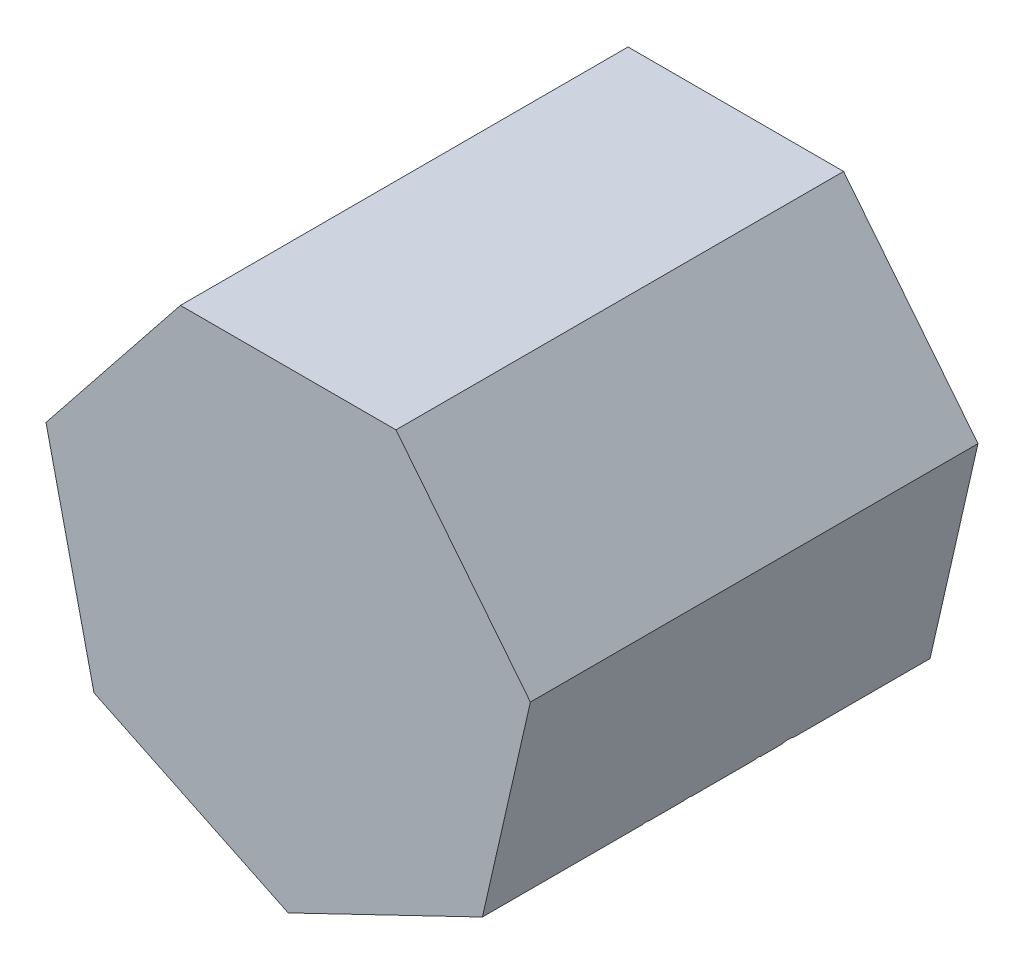
from build123d import *

# Parameters (mm, degrees)
BOSS_EXTRUDE1_DEPTH = 200
CUT_EXTRUDE1_DEPTH  = 1
SKETCH4_W           = 1.794871794
SKETCH4_H           = 20.512820513
SKETCH4_W_2         = 1.794871795
SKETCH4_H_2         = 14.615384616
CUT_EXTRUDE3_DEPTH  = 1
CUT_EXTRUDE5_DEPTH  = 2
CUT_EXTRUDE6_DEPTH  = 1


with BuildPart() as part:
    # Sketch1 → Boss-Extrude1 (new body)
    with BuildSketch(Plane.XY):
        Polygon((0, -110.991626417), (86.776747824, -69.202147163), (108.208834613, 24.697960372), (48.157461881, 100), (-48.157461881, 100), (-108.208834613, 24.697960372), (-86.776747824, -69.202147163), align=None)
    extrude(amount=BOSS_EXTRUDE1_DEPTH)

    # Sketch2 → Cut-Extrude1 (cut)
    # profile 1 of 6: a face of its own
    with BuildSketch(Plane(origin=(-78.183148247, 62.348980186, 0), x_dir=(0, 0, 1), z_dir=(-0.7818314824680302, 0.6234898018587328, 0))):
        with BuildLine():
            Line((145.128205128, -35.364993932), (143.91025641, -36.619000342))
            add(Edge.make_bspline(
                [(143.91025641, -36.619000342), (143.805167819, -36.497210935), (143.602569386, -36.262415294), (143.281246637, -35.9484892), (142.961111759, -35.684849549), (142.64654711, -35.462265212), (142.329642716, -35.293984375), (142.014117469, -35.171156592), (141.699644678, -35.095146274), (141.489438762, -35.085349481), (141.386217949, -35.080538804)],
                knots=[0, 0, 0, 0, 1.26578478, 2.440284043, 3.530471711, 4.527705817, 5.468200915, 6.346673037, 7.188140097, 8, 8, 8, 8], degree=3))
            add(Edge.make_bspline(
                [(141.386217949, -35.080538804), (141.25970715, -35.086680935), (141.010751801, -35.09876778), (140.65403284, -35.219415954), (140.322886411, -35.404608745), (140.036275097, -35.667286365), (139.793488354, -35.968796473), (139.616267319, -36.305918329), (139.50789027, -36.668478579), (139.494148944, -36.920077766), (139.487179487, -37.04768624)],
                knots=[0, 0, 0, 0, 0.99966794, 1.967205029, 2.953328237, 3.988086729, 5.028030931, 6.008226631, 6.989793394, 8, 8, 8, 8], degree=3))
            add(Edge.make_bspline(
                [(139.487179487, -37.04768624), (139.493526986, -37.163183635), (139.50620409, -37.39385284), (139.604756542, -37.734127319), (139.761705526, -38.065881823), (139.908392351, -38.26909843), (139.983974359, -38.373808035)],
                knots=[0, 0, 0, 0, 0.960159726, 1.917612774, 2.927026955, 4, 4, 4, 4], degree=3))
            add(Edge.make_bspline(
                [(139.983974359, -38.373808035), (140.029480038, -38.429719945), (140.126333139, -38.5487214), (140.308096082, -38.713886276), (140.513938956, -38.896413425), (140.761481457, -39.078909636), (141.040058759, -39.271090923), (141.355711812, -39.465388826), (141.698423269, -39.676614111), (141.943779307, -39.810582314), (142.071314103, -39.880218291)],
                knots=[0, 0, 0, 0, 0.66740084, 1.420478572, 2.27185888, 3.217733974, 4.268547843, 5.408967954, 6.65319498, 8, 8, 8, 8], degree=3))
            add(Edge.make_bspline(
                [(142.071314103, -39.880218291), (142.226820257, -39.967332021), (142.527206943, -40.135607064), (142.954022756, -40.396805369), (143.341377276, -40.656413508), (143.69255252, -40.911655073), (144.000791428, -41.169671459), (144.275446014, -41.420572928), (144.509665694, -41.671940404), (144.640830989, -41.847558196), (144.703525641, -41.931500342)],
                knots=[0, 0, 0, 0, 1.27191281, 2.456916733, 3.569705269, 4.599008579, 5.553216877, 6.436649441, 7.252746552, 8, 8, 8, 8], degree=3))
            add(Edge.make_bspline(
                [(144.703525641, -41.931500342), (144.807585798, -42.101020845), (145.014684822, -42.438398109), (145.232160631, -42.99393198), (145.358219344, -43.583134851), (145.375717745, -43.986176109), (145.384615385, -44.191115727)],
                knots=[0, 0, 0, 0, 0.995354457, 1.980940102, 2.973342416, 4, 4, 4, 4], degree=3))
            add(Edge.make_bspline(
                [(145.384615385, -44.191115727), (145.380503763, -44.335510848), (145.372401363, -44.620057209), (145.316069552, -45.039113379), (145.219183973, -45.439882279), (145.087219665, -45.826712477), (144.909023248, -46.192192132), (144.700178693, -46.545542126), (144.449464911, -46.879118874), (144.163228479, -47.19248436), (143.849825657, -47.478688631), (143.515504866, -47.730254082), (143.159854405, -47.939250295), (142.78541554, -48.112195125), (142.391337517, -48.249728027), (141.977558721, -48.344942491), (141.545394409, -48.401929698), (141.251509791, -48.40984099), (141.101762821, -48.413872137)],
                knots=[0, 0, 0, 0, 1.032770009, 2.035186124, 3.017557409, 3.978232242, 4.952395191, 5.920591857, 6.910227898, 7.931268572, 8.952309245, 9.941945286, 10.918353717, 11.897095711, 12.887975737, 13.898235213, 14.929059601, 16, 16, 16, 16], degree=3))
            add(Edge.make_bspline(
                [(141.101762821, -48.413872137), (140.899664675, -48.408199564), (140.498276521, -48.396933237), (139.904620983, -48.291184316), (139.324502362, -48.126639208), (138.762310703, -47.899691013), (138.230618624, -47.613115511), (137.744156198, -47.269901833), (137.301233555, -46.881387562), (137.049129134, -46.583599501), (136.923076923, -46.43470547)],
                knots=[0, 0, 0, 0, 1.013940152, 2.01379169, 3.017749504, 4.037548394, 5.051665909, 6.043208538, 7.021604269, 8, 8, 8, 8], degree=3))
            Line((136.923076923, -46.43470547), (138.112980769, -45.080538804))
            add(Edge.make_bspline(
                [(138.112980769, -45.080538804), (138.225965986, -45.20256603), (138.445004913, -45.439134258), (138.795297581, -45.75413049), (139.151751301, -46.018137754), (139.510806653, -46.238957267), (139.877778621, -46.409102428), (140.250610702, -46.52863725), (140.628544554, -46.605461206), (140.88238533, -46.614479962), (141.009615385, -46.619000342)],
                knots=[0, 0, 0, 0, 1.179806542, 2.287233372, 3.337373186, 4.324005949, 5.273901747, 6.200048787, 7.097828587, 8, 8, 8, 8], degree=3))
            add(Edge.make_bspline(
                [(141.009615385, -46.619000342), (141.182860676, -46.611167057), (141.521352913, -46.595862133), (142.006174391, -46.456907321), (142.453823685, -46.239021882), (142.842528517, -45.929966464), (143.173398009, -45.570220335), (143.412987577, -45.164996796), (143.563137151, -44.726188472), (143.580771429, -44.422003886), (143.58974359, -44.267237522)],
                knots=[0, 0, 0, 0, 1.072336372, 2.095165389, 3.102688358, 4.141489647, 5.156069229, 6.117746104, 7.042326257, 8, 8, 8, 8], degree=3))
            add(Edge.make_bspline(
                [(143.58974359, -44.267237522), (143.583536194, -44.139753987), (143.571280521, -43.888054811), (143.475033252, -43.523767148), (143.322959811, -43.178228402), (143.173218963, -42.976001846), (143.096955128, -42.873006753)],
                knots=[0, 0, 0, 0, 1.013901739, 2.00181326, 2.98231254, 4, 4, 4, 4], degree=3))
            add(Edge.make_bspline(
                [(143.096955128, -42.873006753), (143.051112874, -42.821376112), (142.951251889, -42.708905929), (142.768079082, -42.546476907), (142.548754155, -42.371402054), (142.290810367, -42.186650118), (141.993727727, -41.994658087), (141.656302153, -41.796433217), (141.283156139, -41.582560499), (141.01932396, -41.440733897), (140.881410256, -41.366596496)],
                knots=[0, 0, 0, 0, 0.615000592, 1.339693406, 2.178160186, 3.116406724, 4.166410947, 5.330106347, 6.604359322, 8, 8, 8, 8], degree=3))
            add(Edge.make_bspline(
                [(140.881410256, -41.366596496), (140.732572313, -41.283515744), (140.443928042, -41.122395651), (140.035086379, -40.871446621), (139.666244355, -40.616205051), (139.328526786, -40.370988827), (139.030463897, -40.122869147), (138.773229907, -39.871570567), (138.546697245, -39.62722779), (138.421283463, -39.45410038), (138.361378205, -39.371404188)],
                knots=[0, 0, 0, 0, 1.262093308, 2.447601706, 3.550203992, 4.582594899, 5.537233252, 6.418365656, 7.244515135, 8, 8, 8, 8], degree=3))
            add(Edge.make_bspline(
                [(138.361378205, -39.371404188), (138.257774779, -39.204857817), (138.05053172, -38.871706872), (137.849302056, -38.315647005), (137.710981891, -37.730246678), (137.698625376, -37.326321796), (137.692307692, -37.119801624)],
                knots=[0, 0, 0, 0, 0.985009483, 1.970363186, 2.962279964, 4, 4, 4, 4], degree=3))
            add(Edge.make_bspline(
                [(137.692307692, -37.119801624), (137.695360237, -36.98479935), (137.701334499, -36.720580773), (137.749014794, -36.332358943), (137.835824572, -35.96351235), (137.944709844, -35.608501704), (138.096041298, -35.274204024), (138.276875042, -34.956161332), (138.489374613, -34.654813229), (138.734193418, -34.374795331), (139.003374248, -34.120456324), (139.294201504, -33.898749878), (139.600134398, -33.709570708), (139.922468224, -33.550912648), (140.264299498, -33.430904747), (140.623238849, -33.348291118), (140.998559734, -33.293118531), (141.255137597, -33.28818662), (141.386217949, -33.285667009)],
                knots=[0, 0, 0, 0, 1.087655834, 2.128696564, 3.144119009, 4.137814668, 5.115653402, 6.093965665, 7.082169637, 8.081268856, 9.086088321, 10.061021666, 11.022561449, 11.980240094, 12.950172527, 13.934149372, 14.944599409, 16, 16, 16, 16], degree=3))
            add(Edge.make_bspline(
                [(141.386217949, -33.285667009), (141.541601169, -33.291977527), (141.855282436, -33.304716943), (142.325880299, -33.405892317), (142.795785111, -33.572367198), (143.266204254, -33.802288531), (143.733691622, -34.099813536), (144.202359374, -34.459409533), (144.677833833, -34.878710759), (144.974727051, -35.199277761), (145.128205128, -35.364993932)],
                knots=[0, 0, 0, 0, 0.845714091, 1.707292901, 2.609013841, 3.555613372, 4.552488639, 5.621697636, 6.770543573, 8, 8, 8, 8], degree=3))
        make_face()
    # profile 2 of 6: a face of its own
    with BuildSketch(Plane(origin=(-78.183148247, 62.348980186, 0), x_dir=(0, 0, 1), z_dir=(-0.7818314824680302, 0.6234898018587328, 0))):
        with BuildLine():
            Line((132.251602564, -43.542077265), (133.846153846, -44.379417009))
            add(Edge.make_bspline(
                [(133.846153846, -44.379417009), (133.719087588, -44.604807473), (133.471866968, -45.043328061), (133.046719837, -45.645795835), (132.601050851, -46.187782783), (132.114742462, -46.654809379), (131.602344297, -47.06196015), (131.061014841, -47.418176291), (130.487935882, -47.721710693), (129.883080312, -47.977439424), (129.241368591, -48.174065104), (128.56124564, -48.312946367), (127.841408524, -48.398793616), (127.348001782, -48.408765849), (127.095352564, -48.413872137)],
                knots=[0, 0, 0, 0, 1.120438281, 2.179929193, 3.190490725, 4.156257408, 5.095198341, 6.022838206, 6.959905092, 7.901321166, 8.864066838, 9.862729781, 10.905609505, 12, 12, 12, 12], degree=3))
            add(Edge.make_bspline(
                [(127.095352564, -48.413872137), (126.814541264, -48.40731685), (126.266759769, -48.394529383), (125.469389785, -48.284286729), (124.718650252, -48.104444679), (124.014583375, -47.853213013), (123.35891336, -47.525056876), (122.750337047, -47.125288408), (122.185654042, -46.655961239), (121.682658561, -46.113010133), (121.229836374, -45.531970377), (120.83026026, -44.92650818), (120.496217797, -44.298146897), (120.224488596, -43.65088676), (120.005032225, -42.988807368), (119.852079632, -42.305884696), (119.763909643, -41.603967072), (119.750398526, -41.129125154), (119.743589744, -40.889833676)],
                knots=[0, 0, 0, 0, 1.145258523, 2.234067595, 3.276747158, 4.290159414, 5.277019952, 6.260822364, 7.254936242, 8.264827045, 9.274100331, 10.257902744, 11.220704747, 12.172965371, 13.118907548, 14.062713208, 15.023725156, 16, 16, 16, 16], degree=3))
            add(Edge.make_bspline(
                [(119.743589744, -40.889833676), (119.74964198, -40.665291788), (119.761636713, -40.220279418), (119.837241212, -39.561619163), (119.971231458, -38.921456578), (120.155096166, -38.299259732), (120.392531859, -37.696070395), (120.683001683, -37.11152146), (121.026958127, -36.546234946), (121.292516263, -36.189645611), (121.426282051, -36.010025983)],
                knots=[0, 0, 0, 0, 1.024358464, 2.0301432, 3.019427413, 4.004406732, 4.986367066, 5.972626655, 6.978780325, 8, 8, 8, 8], degree=3))
            add(Edge.make_bspline(
                [(121.426282051, -36.010025983), (121.60746881, -35.79363244), (121.964102791, -35.367700152), (122.567281964, -34.808052576), (123.220425943, -34.339231003), (123.915349521, -33.950618797), (124.660129373, -33.655340814), (125.444753893, -33.435297487), (126.278157243, -33.311994567), (126.847901362, -33.294578375), (127.139423077, -33.285667009)],
                knots=[0, 0, 0, 0, 1.030682036, 2.02871468, 2.997146059, 3.962720338, 4.930598197, 5.918074684, 6.934738563, 8, 8, 8, 8], degree=3))
            add(Edge.make_bspline(
                [(127.139423077, -33.285667009), (127.439123679, -33.293404431), (128.027067941, -33.30858349), (128.884394347, -33.449305395), (129.695598442, -33.67246285), (130.460355609, -33.987627367), (131.178743385, -34.394253377), (131.84609224, -34.897921043), (132.473815168, -35.483167255), (132.839007048, -35.933242738), (133.024839744, -36.162269573)],
                knots=[0, 0, 0, 0, 1.056321875, 2.072262726, 3.055038591, 4.01806755, 4.982017516, 5.957941055, 6.960871419, 8, 8, 8, 8], degree=3))
            add(Edge.make_bspline(
                [(133.024839744, -36.162269573), (133.151279391, -36.334861467), (133.403317066, -36.678896431), (133.71901478, -37.239874471), (133.993057037, -37.826792153), (134.212102529, -38.449136708), (134.389471107, -39.099534309), (134.517795786, -39.782634564), (134.593050749, -40.498234058), (134.607843305, -40.985814375), (134.615384615, -41.234384958)],
                knots=[0, 0, 0, 0, 0.94817472, 1.890038105, 2.849395472, 3.817997239, 4.812318967, 5.836947057, 6.897266129, 8, 8, 8, 8], degree=3))
            Line((134.615384615, -41.234384958), (121.538461538, -41.234384958))
            add(Edge.make_bspline(
                [(121.538461538, -41.234384958), (121.547259289, -41.426959039), (121.564559712, -41.805648203), (121.645217673, -42.359766964), (121.772353523, -42.887614633), (121.951033881, -43.385232016), (122.167415854, -43.859118459), (122.432477093, -44.30575867), (122.748703115, -44.723118271), (123.101421398, -45.114930485), (123.494033371, -45.463849121), (123.907077641, -45.776144985), (124.346469441, -46.037891252), (124.808744203, -46.250347765), (125.293154404, -46.416669571), (125.799852662, -46.530199975), (126.327841898, -46.606240585), (126.687760379, -46.614695815), (126.87099359, -46.619000342)],
                knots=[0, 0, 0, 0, 1.094153842, 2.151609401, 3.174256925, 4.172055639, 5.149267565, 6.128595816, 7.11444997, 8.118368179, 9.117203808, 10.09244225, 11.054858984, 12.015122123, 12.976791628, 13.957293641, 14.960065497, 16, 16, 16, 16], degree=3))
            add(Edge.make_bspline(
                [(126.87099359, -46.619000342), (127.050143005, -46.615525733), (127.40560981, -46.608631441), (127.934986138, -46.54159195), (128.455783437, -46.433190375), (128.965846199, -46.285247575), (129.454822461, -46.10480842), (129.907654176, -45.887077805), (130.324112551, -45.646222109), (130.71335236, -45.370738252), (131.090900893, -45.033548612), (131.465429387, -44.612773063), (131.867010263, -44.115130047), (132.118379365, -43.740583384), (132.251602564, -43.542077265)],
                knots=[0, 0, 0, 0, 0.99110716, 1.966546729, 2.947904876, 3.932708344, 4.903319531, 5.828989031, 6.710028674, 7.56322171, 8.463672341, 9.504779593, 10.677557249, 12, 12, 12, 12], degree=3))
        make_face()
        with BuildLine():
            add(Edge.make_bspline(
                [(132.820512821, -39.439513163), (132.754817823, -39.201439599), (132.6283761, -38.743224624), (132.364168303, -38.10870525), (132.066616642, -37.544774387), (131.714492463, -37.055747912), (131.315528317, -36.621442124), (130.854698701, -36.241907352), (130.337922167, -35.90237906), (129.767869935, -35.615793349), (129.164202592, -35.371851299), (128.532167209, -35.208279209), (127.887265564, -35.096224681), (127.451069642, -35.085789776), (127.231570513, -35.080538804)],
                knots=[0, 0, 0, 0, 1.154881502, 2.222775134, 3.210006277, 4.132804581, 5.035138423, 5.962687519, 6.919655026, 7.923214229, 8.944639381, 9.960483929, 10.97369054, 12, 12, 12, 12], degree=3))
            add(Edge.make_bspline(
                [(127.231570513, -35.080538804), (127.052430864, -35.08403407), (126.698309441, -35.090943476), (126.176589051, -35.156487072), (125.6755622, -35.264829043), (125.191531985, -35.413200223), (124.730841309, -35.610963666), (124.284014062, -35.842867818), (123.862411798, -36.125962583), (123.598747252, -36.341727468), (123.465544872, -36.450731112)],
                knots=[0, 0, 0, 0, 1.04873581, 2.073130211, 3.073294108, 4.04793562, 5.032784715, 6.005352987, 6.992311501, 8, 8, 8, 8], degree=3))
            add(Edge.make_bspline(
                [(123.465544872, -36.450731112), (123.370154689, -36.536984344), (123.177108208, -36.711539864), (122.919162371, -37.012278187), (122.672188241, -37.336572828), (122.447424511, -37.696830683), (122.241266874, -38.08894942), (122.048352719, -38.509621621), (121.874716078, -38.962039509), (121.777024021, -39.27731059), (121.726762821, -39.439513163)],
                knots=[0, 0, 0, 0, 0.879870761, 1.780643979, 2.707998968, 3.669668524, 4.684282772, 5.740141944, 6.837334558, 8, 8, 8, 8], degree=3))
            Line((121.726762821, -39.439513163), (132.820512821, -39.439513163))
        make_face(mode=Mode.SUBTRACT)
    # profile 3 of 6: a face of its own
    with BuildSketch(Plane(origin=(-78.183148247, 62.348980186, 0), x_dir=(0, 0, 1), z_dir=(-0.7818314824680302, 0.6234898018587328, 0))):
        with BuildLine():
            Line((111.538461538, -33.542077265), (113.333333333, -33.542077265))
            Line((113.333333333, -33.542077265), (113.333333333, -35.693519573))
            add(Edge.make_bspline(
                [(113.333333333, -35.693519573), (113.465840526, -35.493200554), (113.719259503, -35.110091987), (114.140476242, -34.603410267), (114.571923849, -34.183895715), (115.015667777, -33.849589893), (115.474971205, -33.599229214), (115.939753786, -33.415840442), (116.4173279, -33.307398641), (116.738253181, -33.29292059), (116.899038462, -33.285667009)],
                knots=[0, 0, 0, 0, 1.2804753, 2.448899062, 3.506932113, 4.484331642, 5.4025378, 6.288909075, 7.142734305, 8, 8, 8, 8], degree=3))
            add(Edge.make_bspline(
                [(116.899038462, -33.285667009), (117.023760327, -33.292470018), (117.280383671, -33.306467651), (117.668855613, -33.404815221), (118.06910391, -33.561832493), (118.327060408, -33.709490908), (118.461538462, -33.786468291)],
                knots=[0, 0, 0, 0, 0.901110191, 1.854092781, 2.881294221, 4, 4, 4, 4], degree=3))
            Line((118.461538462, -33.786468291), (117.475961538, -35.34095547))
            add(Edge.make_bspline(
                [(117.475961538, -35.34095547), (117.389624275, -35.302439664), (117.22573962, -35.22932929), (116.985999242, -35.142803518), (116.764963032, -35.091855428), (116.624142698, -35.084137042), (116.55849359, -35.080538804)],
                knots=[0, 0, 0, 0, 1.180555205, 2.24091978, 3.179933427, 4, 4, 4, 4], degree=3))
            add(Edge.make_bspline(
                [(116.55849359, -35.080538804), (116.414460827, -35.090139017), (116.120675741, -35.10972067), (115.689335745, -35.263656715), (115.270780285, -35.512372372), (114.938370786, -35.788207297), (114.680986483, -36.054194711), (114.497328052, -36.286471297), (114.328855212, -36.54692062), (114.167882524, -36.831090242), (114.021217986, -37.143832219), (113.884334162, -37.48202201), (113.760569231, -37.846051318), (113.689996407, -38.099665719), (113.653846154, -38.229577265)],
                knots=[0, 0, 0, 0, 1.125678352, 2.296057538, 3.5422874, 4.923748041, 5.663163013, 6.437101912, 7.23742474, 8.08941207, 8.991984279, 9.93940061, 10.944477711, 12, 12, 12, 12], degree=3))
            add(Edge.make_bspline(
                [(113.653846154, -38.229577265), (113.626803906, -38.345446829), (113.566907382, -38.602089107), (113.508670023, -39.032652105), (113.45112992, -39.541358727), (113.410577815, -40.129624972), (113.372989003, -40.795981794), (113.351788533, -41.54144434), (113.334056302, -42.366777776), (113.333581634, -42.94377408), (113.333333333, -43.245602906)],
                knots=[0, 0, 0, 0, 0.566838948, 1.255505196, 2.06880316, 3.007127437, 4.065329342, 5.249902469, 6.561414163, 8, 8, 8, 8], degree=3))
            Line((113.333333333, -43.245602906), (113.333333333, -48.157461881))
            Line((113.333333333, -48.157461881), (111.538461538, -48.157461881))
            Line((111.538461538, -48.157461881), (111.538461538, -33.542077265))
        make_face()
    # profile 4 of 6: a face of its own
    with BuildSketch(Plane(origin=(-78.183148247, 62.348980186, 0), x_dir=(0, 0, 1), z_dir=(-0.7818314824680302, 0.6234898018587328, 0))):
        with BuildLine():
            Line((107.948717949, -27.644641368), (107.948717949, -48.157461881))
            Line((107.948717949, -48.157461881), (106.153846154, -48.157461881))
            Line((106.153846154, -48.157461881), (106.153846154, -45.629417009))
            add(Edge.make_bspline(
                [(106.153846154, -45.629417009), (105.951453065, -45.858214689), (105.556480406, -46.304716238), (104.896816875, -46.888042938), (104.197570144, -47.370204775), (103.462134023, -47.759632865), (102.691172632, -48.052158901), (101.886394991, -48.26007981), (101.047472814, -48.393758868), (100.474602216, -48.407107565), (100.184294872, -48.413872137)],
                knots=[0, 0, 0, 0, 1.074387032, 2.096679803, 3.090159297, 4.057316773, 5.018401886, 5.985159533, 6.978961417, 8, 8, 8, 8], degree=3))
            add(Edge.make_bspline(
                [(100.184294872, -48.413872137), (99.926192278, -48.406864296), (99.417202536, -48.393044522), (98.668464953, -48.285831358), (97.947937813, -48.113656377), (97.254940255, -47.874222723), (96.593956567, -47.556618028), (95.959327443, -47.176382325), (95.354340631, -46.723577582), (94.788217551, -46.205931705), (94.266891835, -45.643674636), (93.809398849, -45.043985797), (93.427952678, -44.409458346), (93.108980788, -43.748126038), (92.863287391, -43.054897926), (92.692009481, -42.332171252), (92.584921215, -41.580800546), (92.571107153, -41.069146129), (92.564102564, -40.80970547)],
                knots=[0, 0, 0, 0, 1.033919861, 2.038935746, 3.024066025, 3.998881131, 4.97069526, 5.957263378, 6.95902576, 7.993208707, 9.027059324, 10.027763471, 11.009749337, 11.988697705, 12.965288445, 13.950418724, 14.960734635, 16, 16, 16, 16], degree=3))
            add(Edge.make_bspline(
                [(92.564102564, -40.80970547), (92.571262401, -40.555627164), (92.585417011, -40.05332806), (92.690863982, -39.314592643), (92.868184031, -38.603059724), (93.117028875, -37.921020049), (93.43612576, -37.267648333), (93.824286258, -36.642482476), (94.281538399, -36.043800205), (94.80869501, -35.485678909), (95.37975084, -34.970132542), (95.990657874, -34.522080853), (96.626219481, -34.135127432), (97.296293827, -33.828536138), (97.990962997, -33.580484112), (98.716411259, -33.408867152), (99.46962028, -33.307739602), (99.98099452, -33.293095235), (100.240384615, -33.285667009)],
                knots=[0, 0, 0, 0, 1.020392517, 2.01726096, 2.990465484, 3.961182959, 4.928053699, 5.906110375, 6.912531644, 7.948652711, 8.985773172, 9.998621852, 10.987621588, 11.969261332, 12.953316658, 13.946091881, 14.958173133, 16, 16, 16, 16], degree=3))
            add(Edge.make_bspline(
                [(100.240384615, -33.285667009), (100.538766374, -33.294621843), (101.124456606, -33.312199188), (101.981019586, -33.459092714), (102.791234504, -33.70573773), (103.559765861, -34.043402195), (104.282031919, -34.482263631), (104.963327008, -35.012271904), (105.591803139, -35.648427025), (105.963642125, -36.126207444), (106.153846154, -36.370602906)],
                knots=[0, 0, 0, 0, 1.031072012, 2.023879775, 2.993683497, 3.952812103, 4.918022106, 5.908088563, 6.929940113, 8, 8, 8, 8], degree=3))
            Line((106.153846154, -36.370602906), (106.153846154, -27.644641368))
            Line((106.153846154, -27.644641368), (107.948717949, -27.644641368))
        make_face()
        with BuildLine():
            add(Edge.make_bspline(
                [(100.264423077, -35.080538804), (100.002055432, -35.089873877), (99.484183432, -35.108299825), (98.723931992, -35.252148369), (97.996426768, -35.491488909), (97.305306344, -35.818814058), (96.661487963, -36.230406839), (96.086095559, -36.728243315), (95.574422979, -37.298740538), (95.144090041, -37.939324026), (94.793287201, -38.626055975), (94.546618447, -39.343909907), (94.383937034, -40.07993835), (94.367316916, -40.579153698), (94.358974359, -40.829737522)],
                knots=[0, 0, 0, 0, 1.031046209, 2.035121221, 3.029706178, 4.034933723, 5.034054252, 6.02443088, 7.017295772, 8.038157696, 9.050218397, 10.03989886, 11.016116709, 12, 12, 12, 12], degree=3))
            add(Edge.make_bspline(
                [(94.358974359, -40.829737522), (94.369630892, -41.078823849), (94.390902189, -41.576020168), (94.543763299, -42.313052035), (94.800219719, -43.031075133), (95.150174363, -43.723995095), (95.588383647, -44.367332812), (96.096318805, -44.948704941), (96.678891841, -45.448645445), (97.324191881, -45.867145866), (98.013380284, -46.205217414), (98.738145606, -46.44044964), (99.484863539, -46.592322672), (99.992591161, -46.610062539), (100.248397436, -46.619000342)],
                knots=[0, 0, 0, 0, 0.979072187, 1.954306742, 2.945804271, 3.96968567, 4.997920485, 5.998718438, 6.996577872, 8.005894225, 9.015743152, 10.005417472, 10.995077863, 12, 12, 12, 12], degree=3))
            add(Edge.make_bspline(
                [(100.248397436, -46.619000342), (100.508091737, -46.609514834), (101.024597946, -46.590649099), (101.787104848, -46.446184726), (102.527076064, -46.207505878), (103.234431655, -45.876653726), (103.893380976, -45.466611692), (104.484797419, -44.986571172), (104.984888667, -44.428267263), (105.408846436, -43.814687531), (105.741277389, -43.142047551), (105.983426298, -42.425852175), (106.126591474, -41.666076472), (106.144635644, -41.146854032), (106.153846154, -40.881820855)],
                knots=[0, 0, 0, 0, 1.01762866, 2.023962475, 3.030623092, 4.058876274, 5.077231937, 6.066672613, 7.034107872, 8.005628644, 8.981990164, 9.965428785, 10.961468474, 12, 12, 12, 12], degree=3))
            add(Edge.make_bspline(
                [(106.153846154, -40.881820855), (106.148362403, -40.679890395), (106.137568646, -40.282427347), (106.055108249, -39.698841533), (105.923937241, -39.140363098), (105.739101984, -38.606404875), (105.496294644, -38.099919073), (105.203450268, -37.617269014), (104.855419126, -37.160964949), (104.45780372, -36.737290258), (104.022573991, -36.350853331), (103.562033759, -36.005914812), (103.070726634, -35.722550397), (102.556914994, -35.488028845), (102.019707369, -35.301405132), (101.454732398, -35.176904024), (100.86799533, -35.091416476), (100.467732156, -35.084202871), (100.264423077, -35.080538804)],
                knots=[0, 0, 0, 0, 1.050140795, 2.067009409, 3.05949893, 4.030605086, 5.00011959, 5.97591094, 6.962425594, 7.979863591, 8.993523472, 9.986985069, 10.967611495, 11.937549037, 12.921786183, 13.919465291, 14.943216303, 16, 16, 16, 16], degree=3))
        make_face(mode=Mode.SUBTRACT)
    # profile 5 of 6: a face of its own
    with BuildSketch(Plane(origin=(-78.183148247, 62.348980186, 0), x_dir=(0, 0, 1), z_dir=(-0.7818314824680302, 0.6234898018587328, 0))):
        with BuildLine():
            Line((76.153846154, -33.542077265), (77.948717949, -33.542077265))
            Line((77.948717949, -33.542077265), (77.948717949, -36.178295214))
            add(Edge.make_bspline(
                [(77.948717949, -36.178295214), (78.140361578, -35.939193941), (78.512252727, -35.475209578), (79.131591774, -34.865377723), (79.786128347, -34.36283358), (80.471854082, -33.962240472), (81.189699854, -33.660259751), (81.935289968, -33.442168716), (82.713088288, -33.311398268), (83.242027928, -33.294311237), (83.509615385, -33.285667009)],
                knots=[0, 0, 0, 0, 1.12780773, 2.188550248, 3.19190651, 4.159438251, 5.104880172, 6.052711206, 7.014878035, 8, 8, 8, 8], degree=3))
            add(Edge.make_bspline(
                [(83.509615385, -33.285667009), (83.780076151, -33.295639554), (84.30943311, -33.315158231), (85.080164889, -33.469539323), (85.800012853, -33.733226495), (86.466410315, -34.094438326), (87.067137248, -34.543618174), (87.594707828, -35.066919784), (88.031069241, -35.66884026), (88.323625601, -36.227258296), (88.516343588, -36.722622834), (88.637671231, -37.146889978), (88.740705411, -37.619565127), (88.830029685, -38.139219922), (88.890470325, -38.709495295), (88.938140562, -39.328053535), (88.972304529, -39.994694281), (88.973659998, -40.455760723), (88.974358974, -40.693519573)],
                knots=[0, 0, 0, 0, 1.235846778, 2.418850247, 3.575807741, 4.728682307, 5.871620074, 6.994088408, 8.11269785, 9.256955736, 9.865816715, 10.540099792, 11.271859618, 12.076849838, 12.949306005, 13.892391288, 14.913166135, 16, 16, 16, 16], degree=3))
            Line((88.974358974, -40.693519573), (88.974358974, -48.157461881))
            Line((88.974358974, -48.157461881), (87.179487179, -48.157461881))
            Line((87.179487179, -48.157461881), (87.179487179, -41.282461881))
            add(Edge.make_bspline(
                [(87.179487179, -41.282461881), (87.178383134, -41.083476481), (87.176271282, -40.702851277), (87.169610444, -40.15788543), (87.153554406, -39.66367641), (87.130992618, -39.22140574), (87.097969586, -38.831498102), (87.06355455, -38.493159378), (87.021468968, -38.206819135), (86.983966608, -38.034447236), (86.967147436, -37.957141368)],
                knots=[0, 0, 0, 0, 1.430800155, 2.736877192, 3.918605307, 4.986035426, 5.920637409, 6.731861385, 7.431261377, 8, 8, 8, 8], degree=3))
            add(Edge.make_bspline(
                [(86.967147436, -37.957141368), (86.906430113, -37.730220311), (86.789568052, -37.293467485), (86.500802434, -36.701042613), (86.136149973, -36.197052968), (85.691019405, -35.784614559), (85.169710401, -35.463638349), (84.573669585, -35.240930036), (83.908648781, -35.101637069), (83.440909452, -35.087767743), (83.197115385, -35.080538804)],
                knots=[0, 0, 0, 0, 1.084156227, 2.086665306, 3.027808233, 3.945421172, 4.874247719, 5.839848303, 6.874090471, 8, 8, 8, 8], degree=3))
            add(Edge.make_bspline(
                [(83.197115385, -35.080538804), (83.052728621, -35.08325883), (82.766990947, -35.088641693), (82.343276822, -35.14264911), (81.932281546, -35.230983142), (81.529880352, -35.350232499), (81.144121531, -35.514016895), (80.762611295, -35.69989901), (80.3997155, -35.931603079), (80.047696088, -36.189835201), (79.72019433, -36.4760021), (79.415460968, -36.777970729), (79.143815138, -37.099545608), (78.897708422, -37.435545308), (78.685261203, -37.790584382), (78.499814985, -38.161237562), (78.342468158, -38.547992698), (78.264281344, -38.81642162), (78.225160256, -38.950731112)],
                knots=[0, 0, 0, 0, 1.023777757, 2.026029729, 3.023749952, 4.003683103, 4.997618607, 5.993177895, 7.010360494, 8.046726602, 9.087585522, 10.09234134, 11.086953743, 12.070360549, 13.043493632, 14.017870808, 15.008233677, 16, 16, 16, 16], degree=3))
            add(Edge.make_bspline(
                [(78.225160256, -38.950731112), (78.202647979, -39.049332272), (78.153639928, -39.26398184), (78.100707472, -39.616235665), (78.052664184, -40.023721236), (78.012452992, -40.485963048), (77.987850612, -41.004579477), (77.961025487, -41.577355693), (77.951259424, -42.206575627), (77.94958883, -42.644642442), (77.948717949, -42.873006753)],
                knots=[0, 0, 0, 0, 0.615963638, 1.340920617, 2.168419149, 3.115676021, 4.16674242, 5.331190069, 6.6087489, 8, 8, 8, 8], degree=3))
            Line((77.948717949, -42.873006753), (77.948717949, -48.157461881))
            Line((77.948717949, -48.157461881), (76.153846154, -48.157461881))
            Line((76.153846154, -48.157461881), (76.153846154, -33.542077265))
        make_face()
    # profile 6 of 6: a face of its own
    with BuildSketch(Plane(origin=(-78.183148247, 62.348980186, 0), x_dir=(0, 0, 1), z_dir=(-0.7818314824680302, 0.6234898018587328, 0))):
        Polygon((63.846153846, -28.157461881), (73.076923077, -48.157461881), (71.125801282, -48.157461881), (68.169070513, -41.74720547), (59.102564103, -41.74720547), (56.065705128, -48.157461881), (54.102564103, -48.157461881), (63.58974359, -28.157461881), align=None)
        Polygon((63.697916667, -32.05970547), (60.080128205, -39.695923419), (67.223557692, -39.695923419), align=None, mode=Mode.SUBTRACT)
    extrude(amount=-CUT_EXTRUDE1_DEPTH, mode=Mode.SUBTRACT)

    # Sketch4 → Cut-Extrude3 (cut)
    # profile 1 of 6: a face of its own
    with BuildSketch(Plane(origin=(-97.492791218, -22.252093396, 0), x_dir=(0, 0, 1), z_dir=(-0.9749279121818235, -0.22252093395631528, 0))):
        Polygon((109.743589744, -33.542077265), (111.674679487, -33.542077265), (116.630608974, -44.735987522), (121.650641026, -33.542077265), (123.58974359, -33.542077265), (114.615384615, -53.542077265), (112.676282051, -53.542077265), (115.661057692, -46.90345547), align=None)
    # profile 2 of 6: a face of its own
    with BuildSketch(Plane(origin=(-97.492791218, -22.252093396, 0), x_dir=(0, 0, 1), z_dir=(-0.9749279121818235, -0.22252093395631528, 0))):
        with Locations((106.282051282, -37.901051624)):
            Rectangle(SKETCH4_W, SKETCH4_H)
    # profile 3 of 6: a face of its own
    with BuildSketch(Plane(origin=(-97.492791218, -22.252093396, 0), x_dir=(0, 0, 1), z_dir=(-0.9749279121818235, -0.22252093395631528, 0))):
        with Locations((100.641025641, -37.901051624)):
            Rectangle(SKETCH4_W, SKETCH4_H)
    # profile 4 of 6: a face of its own
    with BuildSketch(Plane(origin=(-97.492791218, -22.252093396, 0), x_dir=(0, 0, 1), z_dir=(-0.9749279121818235, -0.22252093395631528, 0))):
        with BuildLine():
            add(Edge.make_bspline(
                [(94.735576923, -27.388231112), (94.84695587, -27.393397697), (95.065057241, -27.403514863), (95.380447342, -27.490151874), (95.667630268, -27.63700722), (95.92236017, -27.834033968), (96.14094238, -28.065745073), (96.293975011, -28.335807749), (96.39233156, -28.6275714), (96.404209019, -28.831086195), (96.41025641, -28.93470547)],
                knots=[0, 0, 0, 0, 1.055194115, 2.066272739, 3.074728998, 4.095836921, 5.109056067, 6.073838105, 7.019297344, 8, 8, 8, 8], degree=3))
            add(Edge.make_bspline(
                [(96.41025641, -28.93470547), (96.40407264, -29.035634917), (96.391848058, -29.235160489), (96.294050982, -29.521866043), (96.139638194, -29.788176235), (95.922500333, -30.019437436), (95.667593128, -30.216355264), (95.380457209, -30.363239487), (95.065054646, -30.449868843), (94.846954993, -30.459987064), (94.735576923, -30.465154188)],
                knots=[0, 0, 0, 0, 0.96129708, 1.900370562, 2.859976407, 3.87933698, 4.906634145, 5.921202961, 6.938410037, 8, 8, 8, 8], degree=3))
            add(Edge.make_bspline(
                [(94.735576923, -30.465154188), (94.625472494, -30.460184359), (94.411168607, -30.450511234), (94.100500936, -30.361539704), (93.815766711, -30.216305001), (93.56054001, -30.0207268), (93.34779605, -29.786755959), (93.192948476, -29.522028565), (93.095377265, -29.235119111), (93.083122244, -29.035621017), (93.076923077, -28.93470547)],
                knots=[0, 0, 0, 0, 1.054934014, 2.053291228, 3.073705704, 4.106921865, 5.123545215, 6.088680038, 7.033164197, 8, 8, 8, 8], degree=3))
            add(Edge.make_bspline(
                [(93.076923077, -28.93470547), (93.082986429, -28.831100616), (93.094895235, -28.627614144), (93.193021613, -28.335642527), (93.346506229, -28.067176802), (93.560680878, -27.832745377), (93.815729222, -27.637057178), (94.100510623, -27.49185157), (94.411166048, -27.402872488), (94.625471625, -27.393200406), (94.735576923, -27.388231112)],
                knots=[0, 0, 0, 0, 0.98631895, 1.937192651, 2.907499808, 3.917963147, 4.944918757, 5.95915025, 6.951458133, 8, 8, 8, 8], degree=3))
        make_face()
    # profile 5 of 6: a face of its own
    with BuildSketch(Plane(origin=(-97.492791218, -22.252093396, 0), x_dir=(0, 0, 1), z_dir=(-0.9749279121818235, -0.22252093395631528, 0))):
        with Locations((94.743589744, -40.849769573)):
            Rectangle(SKETCH4_W_2, SKETCH4_H_2)
    # profile 6 of 6: a face of its own
    with BuildSketch(Plane(origin=(-97.492791218, -22.252093396, 0), x_dir=(0, 0, 1), z_dir=(-0.9749279121818235, -0.22252093395631528, 0))):
        with BuildLine():
            Line((78.717948718, -28.157461881), (82.620192308, -28.157461881))
            add(Edge.make_bspline(
                [(82.620192308, -28.157461881), (82.811212183, -28.158466169), (83.181456242, -28.160412729), (83.719853053, -28.19060205), (84.224131971, -28.231765878), (84.694439241, -28.297080693), (85.13055754, -28.375890848), (85.533801182, -28.471329797), (85.90288788, -28.585767589), (86.343532089, -28.767746339), (86.845935865, -29.038164444), (87.38992668, -29.437756245), (87.855093762, -29.926513177), (88.256158432, -30.477842637), (88.575021973, -31.084332761), (88.805703672, -31.731528125), (88.951748674, -32.411080936), (88.966768298, -32.877613381), (88.974358974, -33.113391368)],
                knots=[0, 0, 0, 0, 1.001505555, 1.941167018, 2.826882275, 3.653841531, 4.429895133, 5.150066043, 5.825578002, 6.45369114, 7.647487171, 8.808567382, 9.977351308, 11.170798116, 12.373658725, 13.556498008, 14.765093433, 16, 16, 16, 16], degree=3))
            add(Edge.make_bspline(
                [(88.974358974, -33.113391368), (88.968112012, -33.334263115), (88.955836141, -33.768296926), (88.838448945, -34.403120408), (88.654673697, -35.007413087), (88.39921513, -35.578969575), (88.067203723, -36.104875936), (87.673727617, -36.589374599), (87.199003031, -37.011952067), (86.843327374, -37.248197225), (86.662660256, -37.36819906)],
                knots=[0, 0, 0, 0, 1.044552857, 2.05264487, 3.044412934, 4.028983338, 5.005914585, 5.980388656, 6.974128949, 8, 8, 8, 8], degree=3))
            add(Edge.make_bspline(
                [(86.662660256, -37.36819906), (86.8898627, -37.455427626), (87.324557256, -37.622317479), (87.922763042, -37.917377274), (88.438162156, -38.238303619), (88.874717276, -38.588771334), (89.248075304, -38.966535967), (89.574092113, -39.37713662), (89.852271394, -39.825929522), (90.090630957, -40.308235438), (90.276623849, -40.819129543), (90.415914731, -41.353819692), (90.495728726, -41.910388579), (90.507086676, -42.289162175), (90.512820513, -42.480378547)],
                knots=[0, 0, 0, 0, 1.27268992, 2.434971085, 3.483601985, 4.442670788, 5.356604649, 6.2567628, 7.179492994, 8.113709626, 9.066344395, 10.018646069, 10.999752585, 12, 12, 12, 12], degree=3))
            add(Edge.make_bspline(
                [(90.512820513, -42.480378547), (90.507238536, -42.675617817), (90.496255839, -43.059756549), (90.415227429, -43.624071603), (90.278032532, -44.163357013), (90.089054552, -44.681100914), (89.842412755, -45.176301682), (89.542252958, -45.649520333), (89.184358309, -46.096002223), (88.783999058, -46.52070864), (88.331072512, -46.902581711), (87.842411056, -47.242671463), (87.311860656, -47.522363247), (86.748134976, -47.757311941), (86.144910313, -47.936781647), (85.504895413, -48.062339212), (84.82864226, -48.146939423), (84.364586539, -48.15389488), (84.126602564, -48.157461881)],
                knots=[0, 0, 0, 0, 0.978564426, 1.925352924, 2.850884081, 3.763762016, 4.682927383, 5.618979971, 6.567305752, 7.547517671, 8.540179244, 9.531824382, 10.526200242, 11.540722885, 12.589160233, 13.674978461, 14.80764778, 16, 16, 16, 16], degree=3))
            Line((84.126602564, -48.157461881), (78.717948718, -48.157461881))
            Line((78.717948718, -48.157461881), (78.717948718, -28.157461881))
        make_face()
        with BuildLine():
            Line((80.512820513, -30.208743932), (80.512820513, -36.619000342))
            Line((80.512820513, -36.619000342), (81.71875, -36.619000342))
            add(Edge.make_bspline(
                [(81.71875, -36.619000342), (81.895028831, -36.616715068), (82.235635455, -36.612299452), (82.728892007, -36.599650783), (83.186749254, -36.564233392), (83.608416871, -36.528826181), (83.993230837, -36.471257108), (84.340338617, -36.402730692), (84.655187742, -36.330256948), (85.018270859, -36.207002737), (85.430116279, -36.024844593), (85.869162589, -35.742148387), (86.256216701, -35.405437797), (86.583057773, -35.016918016), (86.850551891, -34.58911124), (87.036344549, -34.128843351), (87.16232903, -33.647585454), (87.173709209, -33.317195438), (87.179487179, -33.14944906)],
                knots=[0, 0, 0, 0, 1.156816544, 2.235205308, 3.236616184, 4.169592532, 5.011045266, 5.787822928, 6.49130361, 7.128639758, 8.301311294, 9.436451833, 10.541879658, 11.654887649, 12.756523258, 13.837046038, 14.901820046, 16, 16, 16, 16], degree=3))
            add(Edge.make_bspline(
                [(87.179487179, -33.14944906), (87.176480436, -33.038444652), (87.170582379, -32.820697382), (87.122277793, -32.503272502), (87.040177367, -32.204736773), (86.934724263, -31.920999), (86.787360328, -31.660931284), (86.613854823, -31.415541594), (86.404222307, -31.193186632), (86.165609092, -30.985360927), (85.891274104, -30.801106482), (85.581381008, -30.639730693), (85.231737139, -30.509783397), (84.848235111, -30.395976812), (84.424971754, -30.316043704), (83.966831448, -30.249452918), (83.470061625, -30.215551535), (83.126375325, -30.211063747), (82.948717949, -30.208743932)],
                knots=[0, 0, 0, 0, 0.91205012, 1.789085906, 2.630437955, 3.453916878, 4.269457761, 5.079663411, 5.91843418, 6.774407191, 7.675494373, 8.627863946, 9.638891023, 10.736472738, 11.911756761, 13.175263542, 14.539845004, 16, 16, 16, 16], degree=3))
            Line((82.948717949, -30.208743932), (80.512820513, -30.208743932))
        make_face(mode=Mode.SUBTRACT)
        with BuildLine():
            Line((80.512820513, -38.670282394), (80.512820513, -46.106179829))
            Line((80.512820513, -46.106179829), (83.068910256, -46.106179829))
            add(Edge.make_bspline(
                [(83.068910256, -46.106179829), (83.251875547, -46.103986987), (83.604517025, -46.099760573), (84.113666911, -46.085963118), (84.585570362, -46.054578686), (85.018073994, -46.00517383), (85.415848009, -45.951582692), (85.774120598, -45.87951823), (86.095795989, -45.796952741), (86.468792034, -45.6693289), (86.888812081, -45.471063352), (87.341445546, -45.172124915), (87.743881078, -44.815991728), (88.085625417, -44.403815075), (88.365699637, -43.955636064), (88.569445094, -43.480519779), (88.695107133, -42.986316765), (88.710319529, -42.649364122), (88.717948718, -42.480378547)],
                knots=[0, 0, 0, 0, 1.160039823, 2.235823828, 3.228722157, 4.157150951, 4.99529583, 5.772374946, 6.472645482, 7.099169577, 8.269452708, 9.405989375, 10.527446681, 11.663510218, 12.788923519, 13.866172445, 14.929861265, 16, 16, 16, 16], degree=3))
            add(Edge.make_bspline(
                [(88.717948718, -42.480378547), (88.716370979, -42.374702316), (88.71324095, -42.16505442), (88.666037436, -41.856964025), (88.597386751, -41.558530463), (88.508635701, -41.268943374), (88.379381603, -40.993438367), (88.22848706, -40.726566598), (88.051564765, -40.467975287), (87.775883817, -40.141048124), (87.374901048, -39.764379479), (86.805148046, -39.395593752), (86.157306343, -39.098177711), (85.687434955, -38.97189499), (85.444711538, -38.906660599)],
                knots=[0, 0, 0, 0, 0.723448775, 1.435228256, 2.130040452, 2.821711965, 3.505591119, 4.210454504, 4.921174351, 5.648778258, 7.137944449, 8.670945889, 10.280296675, 12, 12, 12, 12], degree=3))
            add(Edge.make_bspline(
                [(85.444711538, -38.906660599), (85.347402419, -38.886917262), (85.136416177, -38.844109635), (84.792372861, -38.798922759), (84.399596467, -38.758665273), (83.957180026, -38.72888723), (83.464563791, -38.698106981), (82.920695684, -38.686136574), (82.327796743, -38.671855088), (81.916411758, -38.670820035), (81.702724359, -38.670282394)],
                knots=[0, 0, 0, 0, 0.634451884, 1.375622551, 2.216452059, 3.157844607, 4.20941857, 5.370758133, 6.634282058, 8, 8, 8, 8], degree=3))
            Line((81.702724359, -38.670282394), (80.512820513, -38.670282394))
        make_face(mode=Mode.SUBTRACT)
    extrude(amount=-CUT_EXTRUDE3_DEPTH, mode=Mode.SUBTRACT)

    # Sketch7 → Cut-Extrude5 (cut)
    # profile 1 of 4: a face of its own
    with BuildSketch(Plane(origin=(-43.388373912, -90.09688679, 0), x_dir=(-0.9009688679024196, 0.43388373911755734, 0), z_dir=(-0.43388373911755734, -0.9009688679024196, 0))):
        Polygon((-29.107461881, -116.241346154), (-29.107461881, -118.214272837), (-36.899949862, -123.201923077), (-29.107461881, -128.189573317), (-29.107461881, -130.1625), (-38.441656592, -124.190294471), (-48.157461881, -130.406730769), (-48.157461881, -128.433804087), (-39.983363323, -123.201923077), (-48.157461881, -117.970042067), (-48.157461881, -115.997115385), (-38.441656592, -122.217367788), align=None)
    # profile 2 of 4: a face of its own
    with BuildSketch(Plane(origin=(-43.388373912, -90.09688679, 0), x_dir=(-0.9009688679024196, 0.43388373911755734, 0), z_dir=(-0.43388373911755734, -0.9009688679024196, 0))):
        Polygon((-29.107461881, -103.419230769), (-29.107461881, -114.165384615), (-31.061308035, -114.165384615), (-31.061308035, -105.128846154), (-36.922846496, -105.128846154), (-36.922846496, -114.165384615), (-38.87669265, -114.165384615), (-38.87669265, -105.128846154), (-46.203615727, -105.128846154), (-46.203615727, -114.165384615), (-48.157461881, -114.165384615), (-48.157461881, -103.419230769), align=None)
    # profile 3 of 4: a face of its own
    with BuildSketch(Plane(origin=(-43.388373912, -90.09688679, 0), x_dir=(-0.9009688679024196, 0.43388373911755734, 0), z_dir=(-0.43388373911755734, -0.9009688679024196, 0))):
        Polygon((-29.107461881, -91.207692308), (-29.107461881, -92.917307692), (-46.203615727, -92.917307692), (-46.203615727, -100.244230769), (-48.157461881, -100.244230769), (-48.157461881, -91.207692308), align=None)
    # profile 4 of 4: a face of its own
    with BuildSketch(Plane(origin=(-43.388373912, -90.09688679, 0), x_dir=(-0.9009688679024196, 0.43388373911755734, 0), z_dir=(-0.43388373911755734, -0.9009688679024196, 0))):
        Polygon((-29.107461881, -79.484615385), (-48.157461881, -88.276923077), (-48.157461881, -86.418479567), (-42.05169265, -83.60219351), (-42.05169265, -74.966346154), (-48.157461881, -72.069921875), (-48.157461881, -70.203846154), (-29.107461881, -79.240384615), align=None)
        Polygon((-32.820532794, -79.343419471), (-40.097846496, -75.893659856), (-40.097846496, -82.701592548), align=None, mode=Mode.SUBTRACT)
    extrude(amount=-CUT_EXTRUDE5_DEPTH, mode=Mode.SUBTRACT)

    # Sketch8 → Cut-Extrude6 (cut)
    # profile 1 of 7: a face of its own
    with BuildSketch(Plane(origin=(43.388373912, -90.09688679, 0), x_dir=(0.9009688679024189, 0.43388373911755884, 0), z_dir=(0.43388373911755884, -0.9009688679024189, 0))):
        with BuildLine():
            Line((37.92669265, 134.641025641), (37.92669265, 135.897435897))
            Line((37.92669265, 135.897435897), (39.772045214, 135.897435897))
            add(Edge.make_bspline(
                [(39.772045214, 135.897435897), (39.604424062, 136.031354864), (39.279660265, 136.290821115), (38.856171495, 136.727367661), (38.500796673, 137.182555825), (38.220990097, 137.663778582), (38.009371688, 138.166084049), (37.856769876, 138.688046939), (37.765213936, 139.232492387), (37.753255283, 139.602751959), (37.74720547, 139.790064103)],
                knots=[0, 0, 0, 0, 1.127869841, 2.185233117, 3.191641716, 4.159226741, 5.10472073, 6.052603964, 7.014823782, 8, 8, 8, 8], degree=3))
            add(Edge.make_bspline(
                [(37.74720547, 139.790064103), (37.753781446, 139.979482145), (37.766658669, 140.350404784), (37.880451408, 140.888435274), (38.059478669, 141.394014143), (38.313677796, 141.859689238), (38.627604515, 142.280465105), (38.993883756, 142.64868631), (39.412980886, 142.955732219), (39.804066778, 143.16096496), (40.151602951, 143.293587897), (40.448836663, 143.380761911), (40.780132436, 143.451281883), (41.144662721, 143.514472398), (41.54389424, 143.556626946), (41.976873347, 143.590042416), (42.443525308, 143.613943535), (42.766271325, 143.614894322), (42.932702265, 143.615384615)],
                knots=[0, 0, 0, 0, 1.235846195, 2.420061613, 3.574938557, 4.72781258, 5.870749808, 6.993217613, 8.10690044, 9.251157787, 9.865716151, 10.534141144, 11.271861846, 12.076851687, 12.949307443, 13.892392281, 14.913166647, 16, 16, 16, 16], degree=3))
            Line((42.932702265, 143.615384615), (48.157461881, 143.615384615))
            Line((48.157461881, 143.615384615), (48.157461881, 142.358974359))
            Line((48.157461881, 142.358974359), (43.344961881, 142.358974359))
            add(Edge.make_bspline(
                [(43.344961881, 142.358974359), (43.205671901, 142.358204725), (42.939233875, 142.356732546), (42.557760379, 142.352028455), (42.212738582, 142.340955244), (41.903176923, 142.324755614), (41.630208417, 142.30208022), (41.392451356, 142.2778058), (41.192011733, 142.2483645), (41.07135156, 142.222110853), (41.017237522, 142.210336538)],
                knots=[0, 0, 0, 0, 1.430803381, 2.736883362, 3.918614142, 4.976458302, 5.92063272, 6.731858525, 7.431260095, 8, 8, 8, 8], degree=3))
            add(Edge.make_bspline(
                [(41.017237522, 142.210336538), (40.858278665, 142.168045385), (40.553145724, 142.08686448), (40.139964323, 141.882184414), (39.785339091, 141.62971374), (39.496563357, 141.316908364), (39.271758878, 140.952169469), (39.115897331, 140.534890705), (39.018382316, 140.069390698), (39.008675232, 139.741971052), (39.003615727, 139.571314103)],
                knots=[0, 0, 0, 0, 1.084232, 2.08126119, 3.027460722, 3.945137793, 4.874029258, 5.839697328, 6.874011781, 8, 8, 8, 8], degree=3))
            add(Edge.make_bspline(
                [(39.003615727, 139.571314103), (39.005492356, 139.470234385), (39.009206158, 139.270200236), (39.047410719, 138.973731334), (39.107805674, 138.685274469), (39.196810848, 138.405486334), (39.306056812, 138.133458879), (39.437483476, 137.867282788), (39.5992736, 137.613100631), (39.780146875, 137.366729711), (39.980433923, 137.137467011), (40.19181967, 136.924156625), (40.416920069, 136.734003768), (40.652120391, 136.561729271), (40.900647602, 136.413016164), (41.160104866, 136.283203826), (41.430833451, 136.173061043), (41.618733697, 136.118330274), (41.712750342, 136.090945513)],
                knots=[0, 0, 0, 0, 1.023827899, 2.026128959, 3.023898047, 4.006668367, 4.997079741, 5.992687789, 7.009920206, 8.046337072, 9.087246971, 10.092051999, 11.086713115, 12.070168086, 13.043348831, 14.017773728, 15.008185103, 16, 16, 16, 16], degree=3))
            add(Edge.make_bspline(
                [(41.712750342, 136.090945513), (41.781771155, 136.075186919), (41.932025852, 136.040881283), (42.17860353, 136.003828564), (42.46384343, 135.970198262), (42.787412698, 135.942050428), (43.150444198, 135.924828762), (43.55138755, 135.906051175), (43.991841503, 135.89921493), (44.298488274, 135.898045514), (44.458343291, 135.897435897)],
                knots=[0, 0, 0, 0, 0.615963638, 1.340920617, 2.168419149, 3.115676021, 4.16674242, 5.331190069, 6.6087489, 8, 8, 8, 8], degree=3))
            Line((44.458343291, 135.897435897), (48.157461881, 135.897435897))
            Line((48.157461881, 135.897435897), (48.157461881, 134.641025641))
            Line((48.157461881, 134.641025641), (37.92669265, 134.641025641))
        make_face()
    # profile 2 of 7: a face of its own
    with BuildSketch(Plane(origin=(43.388373912, -90.09688679, 0), x_dir=(0.9009688679024189, 0.43388373911755884, 0), z_dir=(0.43388373911755884, -0.9009688679024189, 0))):
        with BuildLine():
            add(Edge.make_bspline(
                [(37.74720547, 126.838942308), (37.751293035, 127.030907399), (37.75930775, 127.407304029), (37.844967613, 127.958535573), (37.97595707, 128.484716117), (38.157043319, 128.987860885), (38.399771121, 129.461526067), (38.689408285, 129.912611044), (39.03253866, 130.339879079), (39.297970933, 130.595971196), (39.432702265, 130.725961538)],
                knots=[0, 0, 0, 0, 1.054011418, 2.066658804, 3.057071809, 4.030435133, 4.997543892, 5.974964718, 6.972108034, 8, 8, 8, 8], degree=3))
            add(Edge.make_bspline(
                [(39.432702265, 130.725961538), (39.561558209, 130.837889355), (39.816776377, 131.059578876), (40.230598829, 131.343841751), (40.659159232, 131.588727991), (41.108148538, 131.784979835), (41.573647223, 131.93971993), (42.057255268, 132.049582715), (42.557904656, 132.114930455), (42.897920009, 132.123742323), (43.070122137, 132.128205128)],
                knots=[0, 0, 0, 0, 1.025258237, 2.030674902, 3.01204498, 3.988269485, 4.97094183, 5.956517959, 6.965070386, 8, 8, 8, 8], degree=3))
            add(Edge.make_bspline(
                [(43.070122137, 132.128205128), (43.243322368, 132.124279779), (43.585574101, 132.116523106), (44.089651564, 132.04314864), (44.578430855, 131.929024297), (45.04986563, 131.765696944), (45.50539694, 131.556264507), (45.943035137, 131.300701757), (46.36364367, 130.997215288), (46.763651023, 130.653199301), (47.132315882, 130.272991796), (47.45362896, 129.860527203), (47.728915058, 129.423911068), (47.95066072, 128.957337655), (48.125499522, 128.465067708), (48.248299587, 127.946039435), (48.322546322, 127.401059154), (48.332080615, 127.028950269), (48.33694906, 126.838942308)],
                knots=[0, 0, 0, 0, 0.998656419, 1.973391657, 2.932242238, 3.890759089, 4.846373663, 5.82037756, 6.809684879, 7.83454468, 8.860553229, 9.859544525, 10.845671541, 11.83227036, 12.833544569, 13.85385346, 14.904124723, 16, 16, 16, 16], degree=3))
            add(Edge.make_bspline(
                [(48.33694906, 126.838942308), (48.332064275, 126.64800343), (48.322497177, 126.274039991), (48.248588047, 125.727136063), (48.125556116, 125.207177587), (47.950086145, 124.714263193), (47.72890797, 124.245683805), (47.454461212, 123.806537818), (47.132220591, 123.393738156), (46.763676843, 123.013450218), (46.363637018, 122.669455797), (45.943036864, 122.365963763), (45.50539649, 122.110402459), (45.04986575, 121.900969643), (44.578430823, 121.737642391), (44.089651573, 121.623518021), (43.585574099, 121.550143562), (43.243322367, 121.542386888), (43.070122137, 121.538461538)],
                knots=[0, 0, 0, 0, 1.099876186, 2.154163076, 3.173186993, 4.173200201, 5.163417411, 6.152872554, 7.150605724, 8.17532212, 9.198891216, 10.186952605, 11.159729845, 12.11414092, 13.071450619, 14.029093627, 15.002601286, 16, 16, 16, 16], degree=3))
            add(Edge.make_bspline(
                [(43.070122137, 121.538461538), (42.898852132, 121.542944105), (42.559766957, 121.551818816), (42.060114159, 121.617255735), (41.577986235, 121.725923128), (41.115029547, 121.882808364), (40.667119376, 122.078695904), (40.23698764, 122.32111747), (39.824973419, 122.608130113), (39.570093699, 122.828958374), (39.441115727, 122.940705128)],
                knots=[0, 0, 0, 0, 1.031377469, 2.041950136, 3.029500481, 4.003457997, 4.981637986, 5.969878303, 6.97268806, 8, 8, 8, 8], degree=3))
            add(Edge.make_bspline(
                [(39.441115727, 122.940705128), (39.30521597, 123.070499492), (39.037945185, 123.325762948), (38.695815089, 123.755157859), (38.400150793, 124.205133143), (38.162245931, 124.684032848), (37.974891861, 125.186764279), (37.8446298, 125.71564125), (37.75961638, 126.268743311), (37.751383669, 126.646981796), (37.74720547, 126.838942308)],
                knots=[0, 0, 0, 0, 1.027980169, 2.021703884, 2.998553061, 3.971491411, 4.943284454, 5.930300938, 6.949603206, 8, 8, 8, 8], degree=3))
        make_face()
        with BuildLine():
            add(Edge.make_bspline(
                [(39.003615727, 126.833333333), (39.007474093, 126.697582888), (39.015091223, 126.429586373), (39.073026844, 126.035108038), (39.164816854, 125.655347407), (39.295233104, 125.289584086), (39.463628604, 124.939051185), (39.670462408, 124.603414378), (39.912992829, 124.281681518), (40.19084896, 123.980165273), (40.494344733, 123.70339146), (40.817811144, 123.461640512), (41.156293356, 123.254917414), (41.510300722, 123.085830193), (41.881040276, 122.956152301), (42.266328722, 122.864260084), (42.667329497, 122.806218379), (42.939981942, 122.798694965), (43.078535599, 122.794871795)],
                knots=[0, 0, 0, 0, 1.02155314, 2.01673505, 2.994700672, 3.958461264, 4.934171024, 5.916582427, 6.921469794, 7.962398674, 8.998583302, 10.009097305, 10.997513862, 11.97957236, 12.956600784, 13.948243505, 14.957359924, 16, 16, 16, 16], degree=3))
            add(Edge.make_bspline(
                [(43.078535599, 122.794871795), (43.257543707, 122.801299089), (43.612841329, 122.814056067), (44.13608582, 122.917797013), (44.638413228, 123.091342132), (45.116878773, 123.325691251), (45.559567885, 123.619316126), (45.954253822, 123.965264393), (46.294997068, 124.359823194), (46.57772045, 124.798289195), (46.802359473, 125.271706467), (46.961555376, 125.772731751), (47.065042145, 126.295294527), (47.075328043, 126.652417452), (47.080538804, 126.833333333)],
                knots=[0, 0, 0, 0, 1.016792936, 2.018143844, 3.017858371, 4.030088057, 5.03801393, 6.028138512, 7.003788237, 7.991172063, 8.984598303, 9.972568034, 10.972917682, 12, 12, 12, 12], degree=3))
            add(Edge.make_bspline(
                [(47.080538804, 126.833333333), (47.075297683, 127.014238809), (47.064951855, 127.371341193), (46.962076576, 127.8931779), (46.801661934, 128.392833788), (46.577973094, 128.865759338), (46.293923435, 129.304025752), (45.956177927, 129.701422237), (45.558522521, 130.044416681), (45.116292406, 130.337751101), (44.639154998, 130.575938072), (44.135993108, 130.748670879), (43.612864941, 130.852661223), (43.257551618, 130.865384537), (43.078535599, 130.871794872)],
                knots=[0, 0, 0, 0, 1.02726834, 2.027799167, 3.010890988, 4.004497153, 4.992059811, 5.971914811, 6.958719428, 7.966827853, 8.981595046, 9.981490638, 10.983022906, 12, 12, 12, 12], degree=3))
            add(Edge.make_bspline(
                [(43.078535599, 130.871794872), (42.939981114, 130.867973021), (42.667327041, 130.860452201), (42.266338109, 130.802391621), (41.881005932, 130.710569107), (41.510427195, 130.580634889), (41.155374884, 130.412298743), (40.818803337, 130.201601633), (40.493224485, 129.960838097), (40.191830086, 129.68072506), (39.912884521, 129.37952352), (39.67036836, 129.057660281), (39.464537618, 128.722521164), (39.29379275, 128.373006624), (39.166003364, 128.007196409), (39.072496844, 127.627967877), (39.015336056, 127.235172642), (39.00754749, 126.968136468), (39.003615727, 126.833333333)],
                knots=[0, 0, 0, 0, 1.042975879, 2.052417305, 3.044379404, 4.0217225, 5.00409729, 5.996508862, 7.007348322, 8.048612455, 9.089876587, 10.095087598, 11.077815406, 12.047498138, 13.018202342, 13.98964644, 14.985148868, 16, 16, 16, 16], degree=3))
        make_face(mode=Mode.SUBTRACT)
    # profile 3 of 7: a face of its own
    with BuildSketch(Plane(origin=(43.388373912, -90.09688679, 0), x_dir=(0.9009688679024189, 0.43388373911755884, 0), z_dir=(0.43388373911755884, -0.9009688679024189, 0))):
        with BuildLine():
            Line((37.92669265, 115.615384615), (37.92669265, 116.871794872))
            Line((37.92669265, 116.871794872), (39.432702265, 116.871794872))
            add(Edge.make_bspline(
                [(39.432702265, 116.871794872), (39.292416177, 116.964490558), (39.024120124, 117.141770338), (38.669757649, 117.437809609), (38.373009033, 117.737807905), (38.139533317, 118.049642631), (37.963082689, 118.370256492), (37.83909636, 118.69694592), (37.762208665, 119.030509787), (37.752213234, 119.255211635), (37.74720547, 119.367788462)],
                knots=[0, 0, 0, 0, 1.280091057, 2.448164201, 3.510831157, 4.48793739, 5.405868014, 6.289422536, 7.142991551, 8, 8, 8, 8], degree=3))
            add(Edge.make_bspline(
                [(37.74720547, 119.367788462), (37.751967577, 119.455093767), (37.76176592, 119.634730108), (37.830609219, 119.906660468), (37.940521309, 120.186834275), (38.0438822, 120.367403824), (38.097766368, 120.461538462)],
                knots=[0, 0, 0, 0, 0.901110191, 1.854092781, 2.881294221, 4, 4, 4, 4], degree=3))
            Line((38.097766368, 120.461538462), (39.185907394, 119.771634615))
            add(Edge.make_bspline(
                [(39.185907394, 119.771634615), (39.158946329, 119.711198531), (39.107769067, 119.596479273), (39.047201027, 119.428661008), (39.011537364, 119.273935661), (39.006134494, 119.175361427), (39.003615727, 119.129407051)],
                knots=[0, 0, 0, 0, 1.180555205, 2.24091978, 3.179933427, 4, 4, 4, 4], degree=3))
            add(Edge.make_bspline(
                [(39.003615727, 119.129407051), (39.010283249, 119.028553847), (39.023883062, 118.822842544), (39.132325724, 118.521837208), (39.302496998, 118.227135708), (39.496271768, 117.995342773), (39.68240938, 117.815235316), (39.845320837, 117.685706603), (40.029684055, 117.569452654), (40.228372984, 117.456683237), (40.446374151, 117.351911934), (40.684043198, 117.258283384), (40.939417544, 117.170722666), (41.116985279, 117.121412504), (41.20794265, 117.096153846)],
                knots=[0, 0, 0, 0, 1.125322384, 2.295331465, 3.535939348, 4.916963136, 5.656144286, 6.429838446, 7.238666481, 8.090384391, 8.983239461, 9.940052224, 10.944811494, 12, 12, 12, 12], degree=3))
            add(Edge.make_bspline(
                [(41.20794265, 117.096153846), (41.289046854, 117.077191558), (41.469587346, 117.034980912), (41.771096945, 116.995035341), (42.127091453, 116.953977807), (42.53798443, 116.925939645), (43.005355356, 116.899453862), (43.527187993, 116.884822024), (44.104916607, 116.872260405), (44.507880048, 116.871955001), (44.719160599, 116.871794872)],
                knots=[0, 0, 0, 0, 0.566841273, 1.261806378, 2.068780918, 3.007109044, 4.065315289, 5.256255371, 6.561408263, 8, 8, 8, 8], degree=3))
            Line((44.719160599, 116.871794872), (48.157461881, 116.871794872))
            Line((48.157461881, 116.871794872), (48.157461881, 115.615384615))
            Line((48.157461881, 115.615384615), (37.92669265, 115.615384615))
        make_face()
    # profile 4 of 7: a face of its own
    with BuildSketch(Plane(origin=(43.388373912, -90.09688679, 0), x_dir=(0.9009688679024189, 0.43388373911755884, 0), z_dir=(0.43388373911755884, -0.9009688679024189, 0))):
        with BuildLine():
            Line((44.92669265, 111.806891026), (45.51283047, 112.923076923))
            add(Edge.make_bspline(
                [(45.51283047, 112.923076923), (45.670566395, 112.834083879), (45.97745804, 112.660938657), (46.399113916, 112.364390967), (46.776184055, 112.050677098), (47.10263048, 111.710251986), (47.390923209, 111.35337408), (47.63959181, 110.973265157), (47.85312316, 110.573027814), (48.028092178, 110.148253638), (48.165645293, 109.699451465), (48.267229208, 109.224017027), (48.326138226, 108.719705499), (48.333288009, 108.374353648), (48.33694906, 108.197516026)],
                knots=[0, 0, 0, 0, 1.120611642, 2.180266485, 3.186550691, 4.152466804, 5.095166165, 6.022949561, 6.960161436, 7.899497276, 8.862391909, 9.862399089, 10.905440174, 12, 12, 12, 12], degree=3))
            add(Edge.make_bspline(
                [(48.33694906, 108.197516026), (48.332360359, 108.000948116), (48.323409132, 107.61750107), (48.246239276, 107.059342077), (48.120349834, 106.53382442), (47.944487692, 106.040977548), (47.71477831, 105.582008748), (47.4349407, 105.156004546), (47.106410481, 104.760729409), (46.726349263, 104.408621309), (46.319604529, 104.091687566), (45.895842094, 103.811833245), (45.456529491, 103.57895433), (45.004280537, 103.386626412), (44.540122919, 103.23491613), (44.061398354, 103.127108465), (43.570005124, 103.065535871), (43.23762269, 103.056058214), (43.070122137, 103.051282051)],
                knots=[0, 0, 0, 0, 1.14524686, 2.234044844, 3.276713788, 4.290115724, 5.276966211, 6.260758605, 7.254862358, 8.264742877, 9.274005885, 10.257798278, 11.220590477, 12.167824544, 13.118936889, 14.062732937, 15.023735098, 16, 16, 16, 16], degree=3))
            add(Edge.make_bspline(
                [(43.070122137, 103.051282051), (42.912942815, 103.055518617), (42.601434157, 103.06391493), (42.140371979, 103.116838079), (41.692258169, 103.210631251), (41.256720377, 103.339336547), (40.834487841, 103.505541532), (40.425303586, 103.708870409), (40.029603027, 103.94963992), (39.779990492, 104.135530615), (39.654256753, 104.229166667)],
                knots=[0, 0, 0, 0, 1.024358464, 2.0301432, 3.019427413, 4.004406732, 4.986367066, 5.972626655, 6.978780325, 8, 8, 8, 8], degree=3))
            add(Edge.make_bspline(
                [(39.654256753, 104.229166667), (39.502530117, 104.355778744), (39.204370529, 104.604585451), (38.816171235, 105.029772493), (38.484099923, 105.483971613), (38.213195491, 105.971751509), (38.004827151, 106.492290545), (37.856617506, 107.042903819), (37.764394695, 107.625113212), (37.753022325, 108.02422412), (37.74720547, 108.228365385)],
                knots=[0, 0, 0, 0, 1.030811313, 2.025658015, 2.997072178, 3.962767568, 4.930766827, 5.917075773, 6.934604948, 8, 8, 8, 8], degree=3))
            add(Edge.make_bspline(
                [(37.74720547, 108.228365385), (37.752594539, 108.438167869), (37.763166664, 108.849752518), (37.862055271, 109.449710562), (38.016970214, 110.018518187), (38.242673932, 110.551481313), (38.522449107, 111.056812119), (38.876071828, 111.522880471), (39.285379615, 111.96248025), (39.60048284, 112.218087789), (39.760827265, 112.348157051)],
                knots=[0, 0, 0, 0, 1.056389096, 2.072394598, 3.055233004, 4.020130009, 4.981825462, 5.957811105, 6.960805292, 8, 8, 8, 8], degree=3))
            add(Edge.make_bspline(
                [(39.760827265, 112.348157051), (39.881641591, 112.436664805), (40.122466066, 112.613091177), (40.515150694, 112.834079577), (40.925993071, 113.025909157), (41.36163426, 113.179241001), (41.816912581, 113.303399006), (42.295082759, 113.393226281), (42.796002405, 113.445904755), (43.137308627, 113.456259545), (43.311308035, 113.461538462)],
                knots=[0, 0, 0, 0, 0.94817472, 1.890038105, 2.849395472, 3.817997239, 4.812318967, 5.836947057, 6.897266129, 8, 8, 8, 8], degree=3))
            Line((43.311308035, 113.461538462), (43.311308035, 104.307692308))
            add(Edge.make_bspline(
                [(43.311308035, 104.307692308), (43.446109892, 104.313850733), (43.711192307, 104.325961029), (44.099075439, 104.382421602), (44.468568808, 104.471416697), (44.816900975, 104.596492948), (45.148621486, 104.747960329), (45.461269633, 104.933503196), (45.753421354, 105.154861411), (46.027689904, 105.401764209), (46.271932949, 105.67659259), (46.490540054, 105.965723579), (46.67376244, 106.273297839), (46.822482, 106.596890173), (46.938907264, 106.935977314), (47.018378546, 107.290666094), (47.071606974, 107.66025856), (47.077525635, 107.912201496), (47.080538804, 108.040464744)],
                knots=[0, 0, 0, 0, 1.094153842, 2.151609401, 3.174256925, 4.172055639, 5.149267565, 6.128595816, 7.11444997, 8.118368179, 9.117203808, 10.09244225, 11.054858984, 12.015122123, 12.976791628, 13.957293641, 14.960065497, 16, 16, 16, 16], degree=3))
            add(Edge.make_bspline(
                [(47.080538804, 108.040464744), (47.078126163, 108.165874806), (47.073339021, 108.414712426), (47.026122863, 108.785195254), (46.95128935, 109.150318535), (46.843506331, 109.506456695), (46.717293869, 109.848419466), (46.568742616, 110.166845139), (46.399377373, 110.457523967), (46.206914989, 110.730261308), (45.970713097, 110.993370935), (45.678788203, 111.258508973), (45.327829287, 111.536531871), (45.06543658, 111.713380017), (44.92669265, 111.806891026)],
                knots=[0, 0, 0, 0, 0.991168677, 1.966668791, 2.94808785, 3.9350306, 4.905702032, 5.828266021, 6.709360349, 7.562606342, 8.463112863, 9.498839253, 10.677475166, 12, 12, 12, 12], degree=3))
        make_face()
        with BuildLine():
            add(Edge.make_bspline(
                [(42.054897778, 112.205128205), (41.888163003, 112.159327933), (41.568086403, 112.071406289), (41.125012562, 111.88416187), (40.728965459, 111.678369673), (40.386526512, 111.430636362), (40.081907999, 111.152689091), (39.819961704, 110.827206117), (39.578530825, 110.468304009), (39.377476379, 110.068834161), (39.212258019, 109.644549676), (39.090771451, 109.204171273), (39.019358007, 108.751387525), (39.00888782, 108.446426698), (39.003615727, 108.29286859)],
                knots=[0, 0, 0, 0, 1.155085888, 2.217389643, 3.210301801, 4.133263417, 5.03575695, 5.95948047, 6.920061569, 7.923798377, 8.943125483, 9.960783337, 10.973185325, 12, 12, 12, 12], degree=3))
            add(Edge.make_bspline(
                [(39.003615727, 108.29286859), (39.006033882, 108.167461253), (39.010814067, 107.919557315), (39.057106808, 107.554491491), (39.131494103, 107.202990161), (39.240869167, 106.866102537), (39.373957004, 106.541593923), (39.537548884, 106.2296988), (39.735334329, 105.934426636), (39.886421598, 105.749881952), (39.962750342, 105.656650641)],
                knots=[0, 0, 0, 0, 1.048823158, 2.073302879, 3.073550078, 4.050623576, 5.03253758, 6.005186856, 6.992227572, 8, 8, 8, 8], degree=3))
            add(Edge.make_bspline(
                [(39.962750342, 105.656650641), (40.023121259, 105.589867048), (40.14529728, 105.454713333), (40.355913154, 105.274314583), (40.583155351, 105.100301023), (40.836943201, 104.945664619), (41.109917133, 104.798705674), (41.40406897, 104.664787971), (41.720640334, 104.543023795), (41.941347183, 104.474670184), (42.054897778, 104.439503205)],
                knots=[0, 0, 0, 0, 0.879905587, 1.780714457, 2.708106151, 3.677566983, 4.684151534, 5.740052498, 6.837288539, 8, 8, 8, 8], degree=3))
            Line((42.054897778, 104.439503205), (42.054897778, 112.205128205))
        make_face(mode=Mode.SUBTRACT)
    # profile 5 of 7: a face of its own
    with BuildSketch(Plane(origin=(43.388373912, -90.09688679, 0), x_dir=(0.9009688679024189, 0.43388373911755884, 0), z_dir=(0.43388373911755884, -0.9009688679024189, 0))):
        with BuildLine():
            Line((37.92669265, 85.282051282), (37.92669265, 86.538461538))
            Line((37.92669265, 86.538461538), (39.704737522, 86.538461538))
            add(Edge.make_bspline(
                [(39.704737522, 86.538461538), (39.549187115, 86.651597338), (39.251137623, 86.868376377), (38.858376486, 87.223838987), (38.525063867, 87.578943436), (38.350092381, 87.834676964), (38.266035599, 87.957532051)],
                knots=[0, 0, 0, 0, 1.134379233, 2.173579362, 3.122582517, 4, 4, 4, 4], degree=3))
            add(Edge.make_bspline(
                [(38.266035599, 87.957532051), (38.186014138, 88.1249907), (38.027369284, 88.456982299), (37.866435048, 88.982659199), (37.767534643, 89.520557877), (37.75400915, 89.883790732), (37.74720547, 90.06650641)],
                knots=[0, 0, 0, 0, 1.014936303, 2.012140481, 3.000054389, 4, 4, 4, 4], degree=3))
            add(Edge.make_bspline(
                [(37.74720547, 90.06650641), (37.751386699, 90.190078331), (37.759661125, 90.434620518), (37.813500313, 90.796957832), (37.906568607, 91.148388673), (38.036184463, 91.486858248), (38.193220132, 91.805691978), (38.37724705, 92.098220913), (38.584234986, 92.359578291), (38.82012671, 92.593952858), (39.098012616, 92.802853066), (39.423222026, 92.993665045), (39.800442242, 93.17231868), (40.073958498, 93.270713407), (40.217958676, 93.322516026)],
                knots=[0, 0, 0, 0, 1.009731074, 1.9982035, 2.985760524, 3.974587072, 4.955028184, 5.885388378, 6.793242796, 7.673688873, 8.594941726, 9.625945874, 10.750113716, 12, 12, 12, 12], degree=3))
            add(Edge.make_bspline(
                [(40.217958676, 93.322516026), (40.119062075, 93.377362034), (39.924447453, 93.485291276), (39.648999026, 93.666499496), (39.391428031, 93.856423018), (39.151200914, 94.056373327), (38.930229926, 94.267190153), (38.724007069, 94.485476785), (38.538243853, 94.716121604), (38.320884173, 95.035147444), (38.089265708, 95.449793025), (37.893508681, 95.974622024), (37.768841086, 96.51849372), (37.754464996, 96.888218929), (37.74720547, 97.074919872)],
                knots=[0, 0, 0, 0, 0.861026002, 1.694378253, 2.508904292, 3.297437177, 4.073006284, 4.833627155, 5.583069468, 6.325614666, 7.772320565, 9.187282923, 10.579656144, 12, 12, 12, 12], degree=3))
            add(Edge.make_bspline(
                [(37.74720547, 97.074919872), (37.753593316, 97.246475529), (37.76609495, 97.582226607), (37.866585587, 98.070196558), (38.032906785, 98.527226603), (38.266806185, 98.948472689), (38.559336306, 99.329039899), (38.907802566, 99.661100018), (39.310932259, 99.937352015), (39.687142632, 100.122034027), (40.019904311, 100.244979535), (40.304721021, 100.321763987), (40.618450729, 100.388287273), (40.960841099, 100.444688988), (41.332585368, 100.485464843), (41.733854338, 100.515777137), (42.164996698, 100.536264811), (42.462458425, 100.537714333), (42.615795214, 100.538461538)],
                knots=[0, 0, 0, 0, 1.209392158, 2.366897878, 3.497663982, 4.628180075, 5.751982922, 6.871462727, 8.009245026, 9.185977379, 9.818124946, 10.509294143, 11.264649411, 12.079922034, 12.956003306, 13.901808055, 14.918415426, 16, 16, 16, 16], degree=3))
            Line((42.615795214, 100.538461538), (48.157461881, 100.538461538))
            Line((48.157461881, 100.538461538), (48.157461881, 99.282051282))
            Line((48.157461881, 99.282051282), (42.61018624, 99.282051282))
            add(Edge.make_bspline(
                [(42.61018624, 99.282051282), (42.479303751, 99.281741262), (42.227767513, 99.281145452), (41.866760243, 99.270351041), (41.537678445, 99.25011545), (41.24009258, 99.226090997), (40.974096038, 99.193616843), (40.74043371, 99.150740834), (40.538039483, 99.105678642), (40.313758312, 99.03063811), (40.066554004, 98.911788195), (39.801900466, 98.727457156), (39.569726365, 98.498698165), (39.368164987, 98.23309513), (39.204159257, 97.930946588), (39.087063907, 97.597875084), (39.014569977, 97.236022385), (39.007346257, 96.985530734), (39.003615727, 96.856169872)],
                knots=[0, 0, 0, 0, 1.253367865, 2.408782419, 3.458086102, 4.410454771, 5.267690823, 6.022776742, 6.685072793, 7.251272234, 8.28433411, 9.300106008, 10.325693114, 11.39283262, 12.482417211, 13.60372085, 14.762494729, 16, 16, 16, 16], degree=3))
            add(Edge.make_bspline(
                [(39.003615727, 96.856169872), (39.010860945, 96.697619466), (39.025167476, 96.38454315), (39.132728052, 95.924860904), (39.31149956, 95.48782635), (39.555999022, 95.076390109), (39.85635131, 94.70139525), (40.211774447, 94.377601071), (40.614395995, 94.110324312), (40.986957887, 93.929299487), (41.321638053, 93.814934242), (41.614031722, 93.739463292), (41.94724725, 93.680403153), (42.317377451, 93.626085653), (42.727573993, 93.589427799), (43.175304037, 93.557044609), (43.663632542, 93.541694699), (44.00214036, 93.539566503), (44.177894573, 93.538461538)],
                knots=[0, 0, 0, 0, 1.091136677, 2.154576964, 3.231646693, 4.331257757, 5.439166191, 6.528231045, 7.628049365, 8.756709726, 9.369482423, 10.061167346, 10.833871401, 11.698739631, 12.636505159, 13.668922441, 14.789697963, 16, 16, 16, 16], degree=3))
            Line((44.177894573, 93.538461538), (48.157461881, 93.538461538))
            Line((48.157461881, 93.538461538), (48.157461881, 92.282051282))
            Line((48.157461881, 92.282051282), (42.955138163, 92.282051282))
            add(Edge.make_bspline(
                [(42.955138163, 92.282051282), (42.808364888, 92.281733558), (42.52598786, 92.281122288), (42.121053153, 92.270417024), (41.752728853, 92.25007052), (41.421442932, 92.226548382), (41.127797822, 92.192707495), (40.870218162, 92.154268977), (40.649353064, 92.108872926), (40.407092192, 92.033719577), (40.140256564, 91.918821133), (39.855499787, 91.734230734), (39.606718457, 91.502794658), (39.391047918, 91.234301884), (39.214814449, 90.929850762), (39.092333524, 90.592808372), (39.017608087, 90.228695691), (39.008367806, 89.977130833), (39.003615727, 89.84775641)],
                knots=[0, 0, 0, 0, 1.320285835, 2.540097241, 3.643286278, 4.638464947, 5.527188413, 6.301437306, 6.980978976, 7.552872752, 8.580906713, 9.583871393, 10.589652407, 11.624542289, 12.671761011, 13.738681301, 14.837052193, 16, 16, 16, 16], degree=3))
            add(Edge.make_bspline(
                [(39.003615727, 89.84775641), (39.009737587, 89.695691603), (39.021938236, 89.392631841), (39.131755037, 88.947423391), (39.303772482, 88.517482883), (39.542407314, 88.109655453), (39.838020441, 87.73499153), (40.185617732, 87.406837414), (40.58055998, 87.132003783), (40.947623568, 86.94783582), (41.274018451, 86.829765974), (41.552621437, 86.752355541), (41.861393631, 86.684409216), (42.200974845, 86.63447322), (42.569849362, 86.586115423), (42.969910286, 86.562805055), (43.400797769, 86.540115626), (43.698288075, 86.539026425), (43.85257406, 86.538461538)],
                knots=[0, 0, 0, 0, 1.09880202, 2.189873405, 3.297736452, 4.440485332, 5.596193377, 6.739822772, 7.886349079, 9.066114917, 9.699498033, 10.395421758, 11.156987371, 11.985484089, 12.878178647, 13.847820956, 14.883825601, 16, 16, 16, 16], degree=3))
            Line((43.85257406, 86.538461538), (48.157461881, 86.538461538))
            Line((48.157461881, 86.538461538), (48.157461881, 85.282051282))
            Line((48.157461881, 85.282051282), (37.92669265, 85.282051282))
        make_face()
    # profile 6 of 7: a face of its own
    with BuildSketch(Plane(origin=(43.388373912, -90.09688679, 0), x_dir=(0.9009688679024189, 0.43388373911755884, 0), z_dir=(0.43388373911755884, -0.9009688679024189, 0))):
        with BuildLine():
            Line((37.92669265, 82.41025641), (48.157461881, 82.41025641))
            Line((48.157461881, 82.41025641), (48.157461881, 81.153846154))
            Line((48.157461881, 81.153846154), (46.38783047, 81.153846154))
            add(Edge.make_bspline(
                [(46.38783047, 81.153846154), (46.547724948, 81.011949813), (46.860225063, 80.734625521), (47.272228202, 80.275806257), (47.605837675, 79.783411972), (47.879190215, 79.269798287), (48.083693745, 78.729934225), (48.22930987, 78.166641485), (48.322865743, 77.579381908), (48.332212505, 77.178374419), (48.33694906, 76.975160256)],
                knots=[0, 0, 0, 0, 1.074325654, 2.099677833, 3.090439787, 4.057542011, 5.018572219, 5.985274637, 6.979019747, 8, 8, 8, 8], degree=3))
            add(Edge.make_bspline(
                [(48.33694906, 76.975160256), (48.332043571, 76.794488441), (48.32236973, 76.438195622), (48.247320515, 75.914079313), (48.126798028, 75.409710315), (47.95919447, 74.924612025), (47.736871184, 74.461923443), (47.470706192, 74.017683056), (47.153742871, 73.594192288), (46.791390758, 73.197906132), (46.397810809, 72.832978131), (45.978028622, 72.51273304), (45.533859406, 72.245720721), (45.070926791, 72.022440398), (44.585667113, 71.85045502), (44.079758441, 71.730560483), (43.553798947, 71.655598696), (43.195640854, 71.645928854), (43.014032394, 71.641025641)],
                knots=[0, 0, 0, 0, 1.033919861, 2.038935746, 3.024066025, 3.998881131, 4.97069526, 5.957263378, 6.95902576, 7.993208707, 9.027059324, 10.027763471, 11.009749337, 11.988697705, 12.965288445, 13.950418724, 14.960734635, 16, 16, 16, 16], degree=3))
            add(Edge.make_bspline(
                [(43.014032394, 71.641025641), (42.836177579, 71.646037527), (42.484568206, 71.655945754), (41.967453414, 71.729758633), (41.469380371, 71.853882668), (40.991952598, 72.028074059), (40.534592398, 72.251441878), (40.096976298, 72.523154227), (39.677898708, 72.843230725), (39.2872138, 73.212240353), (38.926331343, 73.611979434), (38.612695162, 74.039614358), (38.341827766, 74.484507483), (38.127213861, 74.953559525), (37.953577443, 75.439827944), (37.833445571, 75.947641727), (37.762656286, 76.474888042), (37.752405229, 76.83285001), (37.74720547, 77.014423077)],
                knots=[0, 0, 0, 0, 1.020392517, 2.01726096, 2.990465484, 3.961182959, 4.928053699, 5.906110375, 6.912531644, 7.948652711, 8.985773172, 9.998621852, 10.987621588, 11.969261332, 12.953316658, 13.946091881, 14.958173133, 16, 16, 16, 16], degree=3))
            add(Edge.make_bspline(
                [(37.74720547, 77.014423077), (37.752962883, 77.223218558), (37.764252896, 77.632656643), (37.858013235, 78.231624594), (38.016897409, 78.797998593), (38.231530517, 79.337791248), (38.522715751, 79.843572451), (38.879756517, 80.321638428), (39.317414142, 80.761818291), (39.649389297, 81.020909681), (39.819721496, 81.153846154)],
                knots=[0, 0, 0, 0, 1.039007978, 2.037445607, 3.008437381, 3.96246474, 4.921201921, 5.904967172, 6.925065498, 8, 8, 8, 8], degree=3))
            Line((39.819721496, 81.153846154), (37.92669265, 81.153846154))
            Line((37.92669265, 81.153846154), (37.92669265, 82.41025641))
        make_face()
        with BuildLine():
            add(Edge.make_bspline(
                [(39.003615727, 77.03125), (39.01015587, 76.847596601), (39.023065073, 76.485094003), (39.123678175, 75.952860835), (39.291520472, 75.443821968), (39.519721743, 74.958768962), (39.812112697, 74.511227829), (40.156603227, 74.104230082), (40.559008203, 73.750325047), (41.004926707, 73.445967572), (41.485615888, 73.201636582), (41.987939574, 73.028739507), (42.503204422, 72.914921623), (42.852649164, 72.903279649), (43.028054829, 72.897435897)],
                knots=[0, 0, 0, 0, 1.031130969, 2.035288524, 3.029955243, 4.035265425, 5.037320146, 6.024362013, 7.021230137, 8.037832003, 9.049975902, 10.039737725, 11.016035826, 12, 12, 12, 12], degree=3))
            add(Edge.make_bspline(
                [(43.028054829, 72.897435897), (43.202404246, 72.904925574), (43.550419689, 72.919875571), (44.06564031, 73.026247549), (44.566836422, 73.207045642), (45.051388358, 73.451046245), (45.501663981, 73.758985775), (45.911296614, 74.112554223), (46.261175735, 74.521510142), (46.554271574, 74.973052578), (46.790882658, 75.455529366), (46.955555451, 75.962853307), (47.06186389, 76.48555895), (47.074282159, 76.840967869), (47.080538804, 77.020032051)],
                knots=[0, 0, 0, 0, 0.979154007, 1.954470061, 2.941101473, 3.965068436, 4.993389179, 5.998216918, 6.996159742, 8.005560442, 9.015493761, 10.005250788, 10.994993882, 12, 12, 12, 12], degree=3))
            add(Edge.make_bspline(
                [(47.080538804, 77.020032051), (47.073822241, 77.201793293), (47.060463665, 77.563298376), (46.960419798, 78.097704884), (46.788862572, 78.614544733), (46.558307406, 79.110292256), (46.271145013, 79.57167135), (45.934955426, 79.984361856), (45.546658035, 80.337450343), (45.114956925, 80.631422345), (44.644701011, 80.864556506), (44.144543842, 81.035021226), (43.613470204, 81.134687423), (43.250028989, 81.147371608), (43.064513163, 81.153846154)],
                knots=[0, 0, 0, 0, 1.01787422, 2.024450869, 3.03297362, 4.061474925, 5.080076323, 6.069755756, 7.033548292, 8.009625779, 8.9862229, 9.964937832, 10.961217871, 12, 12, 12, 12], degree=3))
            add(Edge.make_bspline(
                [(43.064513163, 81.153846154), (42.923161841, 81.150007528), (42.644937707, 81.142451899), (42.236427637, 81.084729621), (41.845492733, 80.992909915), (41.471721977, 80.863525235), (41.117181915, 80.693560097), (40.779326874, 80.488569034), (40.459914029, 80.244947235), (40.163341745, 79.96661645), (39.892835896, 79.66195564), (39.651378933, 79.339577478), (39.453023842, 78.99566249), (39.288858756, 78.635994342), (39.158222156, 78.259949004), (39.071071381, 77.864466525), (39.011230097, 77.453750577), (39.006180574, 77.173566356), (39.003615727, 77.03125)],
                knots=[0, 0, 0, 0, 1.050140795, 2.067009409, 3.05949893, 4.030605086, 5.00011959, 5.97591094, 6.962425594, 7.979863591, 8.993523472, 9.986985069, 10.967611495, 11.937549037, 12.921786183, 13.919465291, 14.943216303, 16, 16, 16, 16], degree=3))
        make_face(mode=Mode.SUBTRACT)
    # profile 7 of 7: a face of its own
    with BuildSketch(Plane(origin=(43.388373912, -90.09688679, 0), x_dir=(0.9009688679024189, 0.43388373911755884, 0), z_dir=(0.43388373911755884, -0.9009688679024189, 0))):
        with BuildLine():
            Line((36.726372137, 69.487179487), (37.567718291, 68.387820513))
            add(Edge.make_bspline(
                [(37.567718291, 68.387820513), (37.474255648, 68.309396155), (37.288590442, 68.15360477), (37.027854096, 67.902979776), (36.783661008, 67.641729006), (36.554442202, 67.370215956), (36.349410457, 67.082157188), (36.152597729, 66.788528551), (35.980281413, 66.478661216), (35.769775477, 66.052349763), (35.55490211, 65.492487133), (35.370092465, 64.790147765), (35.253555752, 64.05596449), (35.24084842, 63.555193235), (35.234384958, 63.300480769)],
                knots=[0, 0, 0, 0, 0.75789156, 1.505565099, 2.245254514, 2.979266606, 3.711207489, 4.440978832, 5.174393176, 5.91211879, 7.394186119, 8.890401545, 10.418332761, 12, 12, 12, 12], degree=3))
            add(Edge.make_bspline(
                [(35.234384958, 63.300480769), (35.236000808, 63.160147572), (35.239217511, 62.880783602), (35.281654012, 62.466189708), (35.341298852, 62.059337503), (35.429800146, 61.660491639), (35.541690619, 61.2701598), (35.675392287, 60.885790209), (35.840811598, 60.512947745), (36.02364482, 60.146475038), (36.230153926, 59.795357287), (36.455409772, 59.463140379), (36.69687727, 59.15101654), (36.955514334, 58.858810042), (37.229961746, 58.585960076), (37.523294224, 58.335900059), (37.832375952, 58.105288998), (38.157463606, 57.895441191), (38.495529498, 57.706529432), (38.848503779, 57.547684018), (39.210342816, 57.408949508), (39.583611793, 57.297442961), (39.965829769, 57.209869223), (40.358580168, 57.149324771), (40.761118355, 57.107380079), (41.033955133, 57.104178119), (41.171484317, 57.102564103)],
                knots=[0, 0, 0, 0, 1.054877232, 2.099964208, 3.13098259, 4.145888998, 5.169474743, 6.183358035, 7.203388855, 8.234598956, 9.261847606, 10.264062591, 11.251197969, 12.227332808, 13.196685059, 14.158975844, 15.123498106, 16.094582253, 17.066912473, 18.032714859, 19.002806091, 19.979168736, 20.95977404, 21.949109834, 22.966205168, 24, 24, 24, 24], degree=3))
            add(Edge.make_bspline(
                [(41.171484317, 57.102564103), (41.378404984, 57.107623214), (41.784666266, 57.117556107), (42.37981419, 57.205581439), (42.950513623, 57.340419001), (43.492900411, 57.539195166), (44.011496006, 57.789187731), (44.500011373, 58.101109521), (44.965603408, 58.463736899), (45.39699574, 58.880789957), (45.79104507, 59.338425323), (46.138048872, 59.829413762), (46.427308012, 60.352551761), (46.668011903, 60.902058054), (46.853038785, 61.482162572), (46.983295287, 62.091821764), (47.068264007, 62.72970975), (47.076398759, 63.165587349), (47.080538804, 63.387419872)],
                knots=[0, 0, 0, 0, 1.029159485, 2.020618137, 2.987588728, 3.942669054, 4.889339625, 5.846988364, 6.821327795, 7.821533711, 8.827683044, 9.822769455, 10.807800696, 11.797391277, 12.803701919, 13.832062008, 14.896664671, 16, 16, 16, 16], degree=3))
            add(Edge.make_bspline(
                [(47.080538804, 63.387419872), (47.073783685, 63.631830628), (47.060487995, 64.112889463), (46.947850998, 64.818361569), (46.765219327, 65.493704631), (46.509627638, 66.138954977), (46.177366486, 66.752293562), (45.774574976, 67.334680204), (45.297421645, 67.886606486), (44.933089132, 68.218491615), (44.74720547, 68.387820513)],
                knots=[0, 0, 0, 0, 1.028121516, 2.023589091, 2.998037872, 3.967518031, 4.937445131, 5.927275754, 6.942489185, 8, 8, 8, 8], degree=3))
            Line((44.74720547, 68.387820513), (45.580138163, 69.487179487))
            add(Edge.make_bspline(
                [(45.580138163, 69.487179487), (45.69428802, 69.398703946), (45.922040963, 69.222176655), (46.243186395, 68.936390597), (46.544983654, 68.635109531), (46.825925577, 68.317559041), (47.087175025, 67.983179427), (47.328873915, 67.632001371), (47.549739546, 67.264324637), (47.752615472, 66.883069638), (47.931240848, 66.487357851), (48.089529025, 66.080672896), (48.22057415, 65.660521217), (48.331423622, 65.230439564), (48.410464284, 64.786543687), (48.473406074, 64.333993547), (48.510747807, 63.868553432), (48.514523085, 63.55482027), (48.51643624, 63.395833333)],
                knots=[0, 0, 0, 0, 0.986911346, 1.969095443, 2.935967484, 3.900112155, 4.865124501, 5.834589912, 6.812044781, 7.795288262, 8.784678562, 9.777857908, 10.776141921, 11.791195789, 12.811324908, 13.855933174, 14.913475973, 16, 16, 16, 16], degree=3))
            add(Edge.make_bspline(
                [(48.51643624, 63.395833333), (48.51538827, 63.245258665), (48.513316038, 62.947515905), (48.479747369, 62.507920898), (48.433948421, 62.079962575), (48.364987897, 61.664864072), (48.283610536, 61.260360171), (48.17452551, 60.870117833), (48.052328844, 60.490296992), (47.908708897, 60.122423629), (47.746644166, 59.76618483), (47.563477931, 59.422729585), (47.360750472, 59.092215855), (47.14293043, 58.771394172), (46.903021223, 58.465003837), (46.644354685, 58.170389735), (46.367802642, 57.885899831), (46.168383229, 57.709889091), (46.068118932, 57.621394231)],
                knots=[0, 0, 0, 0, 1.114604814, 2.203992996, 3.262667896, 4.300477797, 5.318619304, 6.316056647, 7.298880507, 8.271930387, 9.238335007, 10.195173496, 11.151986948, 12.108099108, 13.064862484, 14.031167946, 15.010108607, 16, 16, 16, 16], degree=3))
            add(Edge.make_bspline(
                [(46.068118932, 57.621394231), (45.893950583, 57.479660902), (45.547716599, 57.197905373), (44.986625575, 56.837266519), (44.401320661, 56.529590867), (43.788411669, 56.278046797), (43.147660332, 56.084831605), (42.480097433, 55.948988765), (41.787057464, 55.861329589), (41.315716952, 55.85126814), (41.076131753, 55.846153846)],
                knots=[0, 0, 0, 0, 0.994611881, 1.977215934, 2.950189954, 3.921972279, 4.908960509, 5.911694611, 6.938501887, 8, 8, 8, 8], degree=3))
            add(Edge.make_bspline(
                [(41.076131753, 55.846153846), (40.824309938, 55.85237462), (40.32886624, 55.864613605), (39.601770427, 55.968596787), (38.905164832, 56.135871972), (38.240349853, 56.373459526), (37.603828732, 56.674680932), (37.000463913, 57.046787387), (36.426396714, 57.485455956), (35.890337709, 57.987246227), (35.400180299, 58.537515568), (34.968955484, 59.126790823), (34.61008542, 59.753918611), (34.31010077, 60.411990018), (34.079522917, 61.105932744), (33.918110171, 61.834266221), (33.817641705, 62.59562188), (33.804940874, 63.115071582), (33.798487522, 63.37900641)],
                knots=[0, 0, 0, 0, 1.032925535, 2.032216505, 3.007276963, 3.968222605, 4.92396291, 5.891752235, 6.871517503, 7.883894988, 8.900124299, 9.891468569, 10.874487609, 11.85992873, 12.854644235, 13.869047385, 14.917252991, 16, 16, 16, 16], degree=3))
            add(Edge.make_bspline(
                [(33.798487522, 63.37900641), (33.800417752, 63.53986377), (33.804238447, 63.858264715), (33.841438705, 64.329282973), (33.903582509, 64.787824163), (33.987721141, 65.234370535), (34.093676771, 65.670213085), (34.225731427, 66.094536423), (34.382951773, 66.506301488), (34.562490122, 66.905374512), (34.764379968, 67.289061531), (34.98623996, 67.657121672), (35.226949099, 68.008087581), (35.488971701, 68.340135085), (35.770134319, 68.653670439), (36.067143524, 68.95334465), (36.387620801, 69.23043449), (36.613248324, 69.401441159), (36.726372137, 69.487179487)],
                knots=[0, 0, 0, 0, 1.096622143, 2.170653093, 3.219033441, 4.250379162, 5.267604342, 6.275621678, 7.278284436, 8.271072515, 9.257558938, 10.232633088, 11.19973724, 12.157384997, 13.114417402, 14.069920322, 15.032307892, 16, 16, 16, 16], degree=3))
        make_face()
    extrude(amount=-CUT_EXTRUDE6_DEPTH, mode=Mode.SUBTRACT)


solid = part.part
